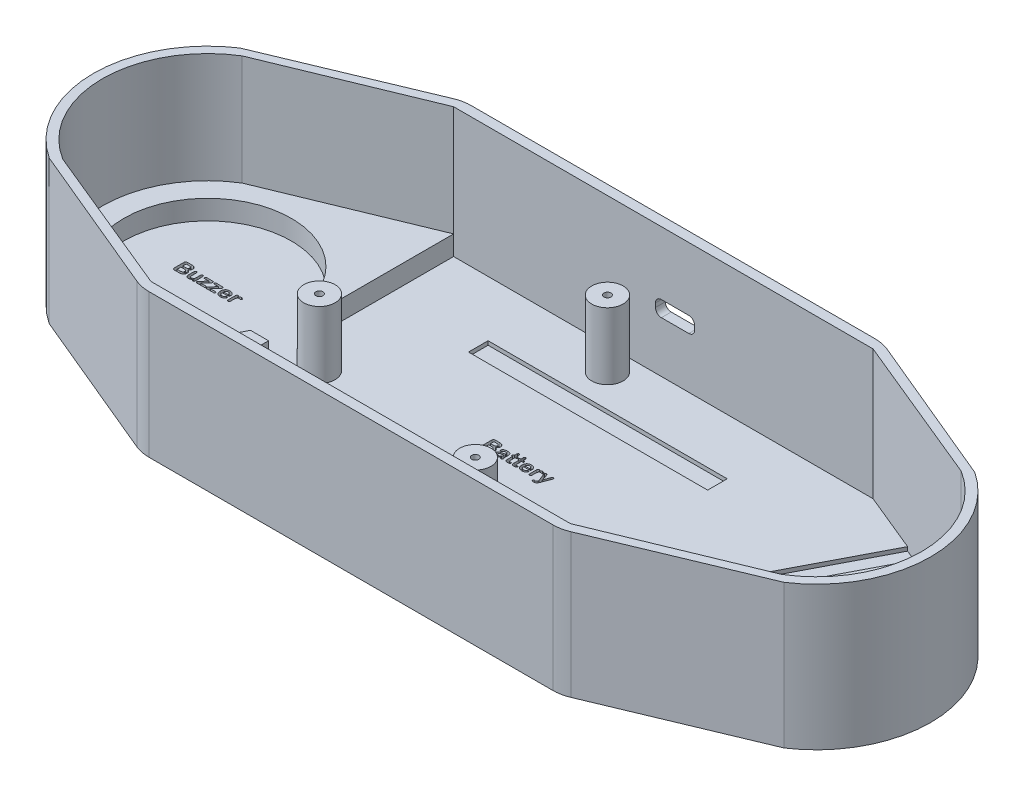
from build123d import *

# Parameters (mm, degrees)
MAINEXTRUDE_DEPTH         = 33.1
MAINCUT_DEPTH             = 50.8
BASSEXTRUDE_START         = -3.5
BASSEXTRUDE_DEPTH         = 3.5
FILLET1_R                 = 10
BUZZER_DEPTH              = 5
TEXT_2_DEPTH              = 1
SKETCH10_W                = 61
SKETCH10_H                = 5
SKETCH10_W_2              = 30.5
BATTERY_COVER_MOLDS_DEPTH = 1
SKETCH11_R                = 4
SKETCH11_R_2              = 0.9
PCB_OFFSETS_DEPTH         = 17
USB_REACH                 = 182.979
SKETCH12_W                = 10
SKETCH12_H                = 4
FILLET2_R                 = 1.5
CUT_EXTRUDE1_DEPTH        = 1


with BuildPart() as part:
    # Sketch2 → MainExtrude (new body)
    with BuildSketch(Plane(origin=(0, 0, 0), x_dir=(1, 0, 0), z_dir=(0, 1, 0))):
        with BuildLine():
            Line((-2.5, 2.5), (104.5, 2.5))
            Line((104.5, 2.5), (144.737244829, -14.291091061))
            ThreePointArc((144.737244829, -14.291091061), (157.8, -38.6), (144.737244829, -62.908908939))
            Line((144.737244829, -62.908908939), (104.5, -79.7))
            Line((104.5, -79.7), (-2.5, -79.7))
            Line((-2.5, -79.7), (-42.737244829, -62.908908939))
            ThreePointArc((-42.737244829, -62.908908939), (-55.8, -38.6), (-42.737244829, -14.291091061))
            Line((-42.737244829, -14.291091061), (-2.5, 2.5))
        make_face()
    extrude(amount=MAINEXTRUDE_DEPTH)

    # Sketch2<5> → MainCut (cut)
    with BuildSketch(Plane(origin=(0, 0, 0), x_dir=(1, 0, 0), z_dir=(0, 1, 0))):
        with BuildLine():
            Line((0, 0), (102, 0))
            Line((102, 0), (104.5, 0))
            Line((104.5, 0), (142.702591635, -15.743739118))
            ThreePointArc((142.702591635, -15.743739118), (155.480653983, -38.6), (142.702591635, -61.456260882))
            Line((142.702591635, -61.456260882), (104.5, -77.2))
            Line((104.5, -77.2), (102, -77.2))
            Line((102, -77.2), (0, -77.2))
            Line((0, -77.2), (-2.5, -77.2))
            Line((-2.5, -77.2), (-40.702591635, -61.456260882))
            ThreePointArc((-40.702591635, -61.456260882), (-53.480653983, -38.6), (-40.702591635, -15.743739118))
            Line((-40.702591635, -15.743739118), (-2.5, 0))
            Line((-2.5, 0), (0, 0))
        make_face()
    extrude(amount=MAINCUT_DEPTH, mode=Mode.SUBTRACT)

    # Sketch2<6> → BassExtrude (add)
    with BuildSketch(Plane(origin=(0, 0, 0), x_dir=(1, 0, 0), z_dir=(0, 1, 0)).offset(BASSEXTRUDE_START)):
        with BuildLine():
            Line((-2.5, 2.5), (104.5, 2.5))
            Line((104.5, 2.5), (144.737244829, -14.291091061))
            ThreePointArc((144.737244829, -14.291091061), (157.8, -38.6), (144.737244829, -62.908908939))
            Line((144.737244829, -62.908908939), (104.5, -79.7))
            Line((104.5, -79.7), (-2.5, -79.7))
            Line((-2.5, -79.7), (-42.737244829, -62.908908939))
            ThreePointArc((-42.737244829, -62.908908939), (-55.8, -38.6), (-42.737244829, -14.291091061))
            Line((-42.737244829, -14.291091061), (-2.5, 2.5))
        make_face()
    extrude(amount=BASSEXTRUDE_DEPTH)

    # Fillet1
    fillet1_edges = [part.edges().sort_by_distance(p)[0] for p in [
        (104.5, 14.8, -2.5),
        (-2.5, 14.8, -2.5),
        (104.5, 14.8, 79.7),
        (-2.5, 14.8, 79.7),
    ]]
    fillet(fillet1_edges, radius=FILLET1_R)

    # Sketch6 → Buzzer (add)
    with BuildSketch(Plane(origin=(0, 0, 0), x_dir=(1, 0, 0), z_dir=(0, 1, 0))):
        with BuildLine():
            Line((-2.5, 0), (-2.5, -30))
            Line((-2.5, -30), (-7.100063939, -30))
            ThreePointArc((-7.100063939, -30), (-48.007902519, -38.6), (-7.100063939, -47.2))
            Line((-7.100063939, -47.2), (-2.5, -47.2))
            Line((-2.5, -47.2), (-2.5, -77.2))
            Line((-2.5, -77.2), (-40.702591635, -61.456260882))
            ThreePointArc((-40.702591635, -61.456260882), (-53.480653983, -38.6), (-40.702591635, -15.743739118))
            Line((-40.702591635, -15.743739118), (-2.5, 0))
        make_face()
    extrude(amount=BUZZER_DEPTH)

    # Sketch8 → Text 2 (cut)
    # profile 1 of 20: a face of its own
    with BuildSketch(Plane(origin=(0, 0, 0), x_dir=(1, 0, 0), z_dir=(0, 1, 0))):
        with BuildLine():
            Line((-21.077826991, -37.737304687), (-21.077826991, -38.261621094))
            add(Edge.make_bspline(
                [(-21.077826991, -38.261621094), (-21.078743598, -38.291555749), (-21.080473832, -38.348061935), (-21.096685556, -38.427007978), (-21.123892906, -38.494561888), (-21.162716624, -38.549380367), (-21.20987706, -38.591921733), (-21.263932483, -38.621921931), (-21.323887979, -38.640329071), (-21.365943788, -38.642590929), (-21.38749496, -38.64375)],
                knots=[0, 0, 0, 0, 1.292414504, 2.439627698, 3.46375878, 4.417332263, 5.316903122, 6.185375834, 7.070109971, 8, 8, 8, 8], degree=3))
            add(Edge.make_bspline(
                [(-21.38749496, -38.64375), (-21.408811222, -38.642592119), (-21.450188357, -38.64034455), (-21.509315323, -38.622087333), (-21.561576004, -38.590831704), (-21.608331386, -38.5489347), (-21.645318225, -38.493691089), (-21.672152661, -38.427227909), (-21.687486024, -38.349350673), (-21.689342129, -38.293820267), (-21.690326991, -38.264355469)],
                knots=[0, 0, 0, 0, 0.933294383, 1.81162385, 2.680186499, 3.585258456, 4.541104918, 5.566887721, 6.708974649, 8, 8, 8, 8], degree=3))
            Line((-21.690326991, -38.264355469), (-21.690326991, -36.526660156))
            add(Edge.make_bspline(
                [(-21.690326991, -36.526660156), (-21.68947206, -36.493793432), (-21.687866447, -36.432067763), (-21.674549456, -36.34577407), (-21.652100802, -36.272036368), (-21.618660935, -36.211573689), (-21.576488272, -36.163130081), (-21.52312796, -36.129252265), (-21.460317801, -36.110028202), (-21.415657975, -36.107548196), (-21.392280116, -36.10625)],
                knots=[0, 0, 0, 0, 1.34619872, 2.528241455, 3.567694465, 4.487339067, 5.340335725, 6.171799567, 7.043000931, 8, 8, 8, 8], degree=3))
            add(Edge.make_bspline(
                [(-21.392280116, -36.10625), (-21.368459953, -36.107322007), (-21.323701205, -36.109336337), (-21.2615399, -36.127044493), (-21.209978479, -36.15799681), (-21.170252342, -36.202368203), (-21.139849326, -36.257679327), (-21.117777191, -36.323909497), (-21.103869745, -36.401498512), (-21.100256557, -36.456874961), (-21.098334804, -36.486328125)],
                knots=[0, 0, 0, 0, 1.044883286, 1.963364657, 2.807970932, 3.650974255, 4.547373518, 5.563477854, 6.704082887, 8, 8, 8, 8], degree=3))
            add(Edge.make_bspline(
                [(-21.098334804, -36.486328125), (-21.079871111, -36.456631468), (-21.044556032, -36.399831357), (-20.986724766, -36.322972828), (-20.92909288, -36.25688943), (-20.869169997, -36.201623906), (-20.803386875, -36.157143274), (-20.727359786, -36.127420725), (-20.641847174, -36.109475258), (-20.58163349, -36.107358691), (-20.550092616, -36.10625)],
                knots=[0, 0, 0, 0, 1.18924255, 2.274636787, 3.268721947, 4.168850259, 5.041860026, 5.953170485, 6.927838526, 8, 8, 8, 8], degree=3))
            add(Edge.make_bspline(
                [(-20.550092616, -36.10625), (-20.51720947, -36.107515125), (-20.451200809, -36.110054699), (-20.353247223, -36.128151245), (-20.257083154, -36.158998544), (-20.179580614, -36.193360452), (-20.121691521, -36.226542883), (-20.083198725, -36.253239033), (-20.051243721, -36.282827859), (-20.023951592, -36.313533808), (-20.003030507, -36.346762118), (-19.988712752, -36.38222059), (-19.979233571, -36.419524906), (-19.978365059, -36.445253911), (-19.977924648, -36.458300781)],
                knots=[0, 0, 0, 0, 1.609451603, 3.230765888, 4.857137694, 6.544750347, 7.369389467, 8.121503283, 8.832102741, 9.496362917, 10.127778221, 10.743023735, 11.362602371, 12, 12, 12, 12], degree=3))
            add(Edge.make_bspline(
                [(-19.977924648, -36.458300781), (-19.978680721, -36.476434934), (-19.980145399, -36.511564748), (-19.996332116, -36.561465036), (-20.020886777, -36.606925113), (-20.056027041, -36.645020515), (-20.095885117, -36.676329313), (-20.138689635, -36.699199495), (-20.183215608, -36.713788041), (-20.213659447, -36.715732139), (-20.228803554, -36.716699219)],
                knots=[0, 0, 0, 0, 1.088483127, 2.10862957, 3.128406662, 4.178128692, 5.204900727, 6.16884502, 7.089102868, 8, 8, 8, 8], degree=3))
            add(Edge.make_bspline(
                [(-20.228803554, -36.716699219), (-20.236576815, -36.715943621), (-20.256688825, -36.713988638), (-20.292325276, -36.704739455), (-20.340512443, -36.691963417), (-20.397596158, -36.673932093), (-20.458687744, -36.65444453), (-20.519698183, -36.642079069), (-20.5764824, -36.632962342), (-20.613178893, -36.631804575), (-20.630756679, -36.63125)],
                knots=[0, 0, 0, 0, 0.454029574, 1.174725489, 2.136679894, 3.357464208, 4.658256254, 5.865202561, 6.977422421, 8, 8, 8, 8], degree=3))
            add(Edge.make_bspline(
                [(-20.630756679, -36.63125), (-20.65267771, -36.63226505), (-20.695101617, -36.634229483), (-20.756149995, -36.646585024), (-20.810167717, -36.670674712), (-20.858497077, -36.702345102), (-20.900172473, -36.744251023), (-20.936983111, -36.794245715), (-20.968460976, -36.853333063), (-20.994796652, -36.920422046), (-21.016145483, -36.995236912), (-21.034520701, -37.076727793), (-21.0496511, -37.165002718), (-21.060132953, -37.260911451), (-21.068411485, -37.365319943), (-21.073504452, -37.479777204), (-21.076991883, -37.604893873), (-21.077540985, -37.691956883), (-21.077826991, -37.737304687)],
                knots=[0, 0, 0, 0, 0.794050632, 1.536731085, 2.238662641, 2.922771156, 3.616952249, 4.366019506, 5.163320251, 6.033432924, 6.970572952, 7.977209821, 9.05675488, 10.211001348, 11.468820729, 12.84806026, 14.358274693, 16, 16, 16, 16], degree=3))
        make_face()
    # profile 2 of 20: a face of its own
    with BuildSketch(Plane(origin=(0, 0, 0), x_dir=(1, 0, 0), z_dir=(0, 1, 0))):
        with BuildLine():
            Line((-22.77655746, -37.50625), (-24.009076991, -37.50625))
            add(Edge.make_bspline(
                [(-24.009076991, -37.50625), (-24.007871775, -37.54050984), (-24.005510154, -37.607642015), (-23.987751688, -37.704799922), (-23.961351053, -37.796051007), (-23.924534116, -37.880178801), (-23.878589056, -37.955719266), (-23.8267399, -38.023232232), (-23.766600162, -38.079761377), (-23.699878245, -38.125891175), (-23.6277054, -38.161111212), (-23.55193915, -38.187825623), (-23.472126742, -38.202770727), (-23.417825652, -38.205083132), (-23.390424648, -38.20625)],
                knots=[0, 0, 0, 0, 1.179639705, 2.311504614, 3.392005435, 4.44652888, 5.46432702, 6.431680492, 7.370191764, 8.295643874, 9.215452015, 10.129041871, 11.055891293, 12, 12, 12, 12], degree=3))
            add(Edge.make_bspline(
                [(-23.390424648, -38.20625), (-23.354344988, -38.204901959), (-23.284833636, -38.202304814), (-23.183776953, -38.183228093), (-23.089964103, -38.147801168), (-23.001389537, -38.09969969), (-22.919114496, -38.041546046), (-22.852748068, -37.989032118), (-22.799708742, -37.942051298), (-22.755032981, -37.901005221), (-22.703962542, -37.855277789), (-22.668714297, -37.822367176), (-22.650092616, -37.804980469)],
                knots=[0, 0, 0, 0, 1.247905556, 2.404224554, 3.538983975, 4.702801183, 5.881313568, 7.020008393, 7.628790321, 8.331868978, 9.11872483, 10, 10, 10, 10], degree=3))
            add(Edge.make_bspline(
                [(-22.650092616, -37.804980469), (-22.641432631, -37.798664417), (-22.623406333, -37.785517162), (-22.590375585, -37.772827874), (-22.552439987, -37.765514021), (-22.52548771, -37.76449853), (-22.511323085, -37.763964844)],
                knots=[0, 0, 0, 0, 0.868866131, 1.808598965, 2.848320883, 4, 4, 4, 4], degree=3))
            add(Edge.make_bspline(
                [(-22.511323085, -37.763964844), (-22.495749522, -37.764510974), (-22.466049804, -37.765552476), (-22.424102867, -37.776480706), (-22.386160017, -37.792514376), (-22.353936665, -37.817106482), (-22.326801456, -37.846830412), (-22.308049303, -37.883410036), (-22.295952673, -37.924979255), (-22.295079778, -37.954822893), (-22.294623866, -37.970410156)],
                knots=[0, 0, 0, 0, 1.102465736, 2.102468148, 3.057950005, 4.00546365, 4.956145095, 5.889200524, 6.897534264, 8, 8, 8, 8], degree=3))
            add(Edge.make_bspline(
                [(-22.294623866, -37.970410156), (-22.295519034, -37.985514577), (-22.297416669, -38.017533916), (-22.310558862, -38.067069834), (-22.332294827, -38.119761652), (-22.361659753, -38.175464467), (-22.398838035, -38.232880057), (-22.446132607, -38.288793124), (-22.500901121, -38.34446355), (-22.564533445, -38.398157518), (-22.636138207, -38.449559597), (-22.716873638, -38.496395146), (-22.806729163, -38.537394308), (-22.904258306, -38.575443278), (-23.010050095, -38.606227579), (-23.124042111, -38.627726535), (-23.245371913, -38.641912735), (-23.329086982, -38.64312768), (-23.371967616, -38.64375)],
                knots=[0, 0, 0, 0, 0.525537938, 1.114069654, 1.772306998, 2.506549159, 3.302753817, 4.147512317, 5.050313588, 6.017967943, 7.041213872, 8.114344659, 9.260276936, 10.47524946, 11.755151616, 13.087980653, 14.508401902, 16, 16, 16, 16], degree=3))
            add(Edge.make_bspline(
                [(-23.371967616, -38.64375), (-23.421000456, -38.64268888), (-23.516593401, -38.640620152), (-23.655468827, -38.6249168), (-23.785569269, -38.598552135), (-23.906585554, -38.560614588), (-24.019298723, -38.51319878), (-24.122772676, -38.453893119), (-24.216893369, -38.383689553), (-24.302111122, -38.303472224), (-24.377015227, -38.213461976), (-24.443305793, -38.116315317), (-24.497907966, -38.010657469), (-24.543288639, -37.897837544), (-24.578691403, -37.777418449), (-24.603885856, -37.649303072), (-24.619140171, -37.513686139), (-24.620751696, -37.420613602), (-24.621576991, -37.372949219)],
                knots=[0, 0, 0, 0, 1.161895415, 2.265196273, 3.307380836, 4.303185105, 5.266158709, 6.199917451, 7.122316156, 8.043005893, 8.966794753, 9.89246016, 10.824859252, 11.779559524, 12.770652002, 13.794812853, 14.87067777, 16, 16, 16, 16], degree=3))
            add(Edge.make_bspline(
                [(-24.621576991, -37.372949219), (-24.620750322, -37.327787163), (-24.619121437, -37.238799026), (-24.603462122, -37.107846683), (-24.579079841, -36.981869864), (-24.545181862, -36.86109299), (-24.500745887, -36.747558667), (-24.448216706, -36.641113687), (-24.385495812, -36.543752253), (-24.314518117, -36.454159081), (-24.233156199, -36.374384094), (-24.142156335, -36.304039645), (-24.041301329, -36.243943784), (-23.931198574, -36.193998512), (-23.813052147, -36.154311467), (-23.687424047, -36.126836066), (-23.55522893, -36.108964864), (-23.464769057, -36.10716934), (-23.418451991, -36.10625)],
                knots=[0, 0, 0, 0, 1.095507523, 2.15860795, 3.195309999, 4.206995944, 5.197887526, 6.149926361, 7.082497361, 8.003040645, 8.917987058, 9.840388418, 10.787726911, 11.760164811, 12.769081724, 13.806049167, 14.876658106, 16, 16, 16, 16], degree=3))
            add(Edge.make_bspline(
                [(-23.418451991, -36.10625), (-23.388126065, -36.106492315), (-23.328741274, -36.106966822), (-23.241389958, -36.11516352), (-23.157134373, -36.126499456), (-23.075882176, -36.142489392), (-22.998459527, -36.164833925), (-22.924139137, -36.19074284), (-22.852957461, -36.22135615), (-22.785523373, -36.257258876), (-22.72115426, -36.295648165), (-22.661879403, -36.338745129), (-22.60547126, -36.382602252), (-22.553904476, -36.430449552), (-22.50601103, -36.480600288), (-22.463137215, -36.534262423), (-22.423544291, -36.58986635), (-22.378117014, -36.667411557), (-22.330552299, -36.766964199), (-22.288144833, -36.889214664), (-22.262515143, -37.013450489), (-22.259308167, -37.09689009), (-22.257709804, -37.138476563)],
                knots=[0, 0, 0, 0, 1.048847282, 2.053872234, 3.03283051, 3.989924751, 4.915857681, 5.818505585, 6.711913066, 7.593554535, 8.460263899, 9.302531452, 10.127499996, 10.930978608, 11.734070318, 12.524563272, 13.305443929, 14.093732096, 15.631266151, 17.114748765, 18.561984696, 20, 20, 20, 20], degree=3))
            add(Edge.make_bspline(
                [(-22.257709804, -37.138476563), (-22.258075939, -37.156950286), (-22.258774317, -37.192187729), (-22.264766524, -37.242641004), (-22.275538355, -37.287876309), (-22.290872735, -37.328206752), (-22.309437949, -37.363941258), (-22.333402025, -37.393953017), (-22.361124221, -37.419277123), (-22.405876029, -37.445937316), (-22.471538887, -37.470750953), (-22.561191571, -37.491638337), (-22.664314384, -37.504395032), (-22.737781847, -37.505609181), (-22.77655746, -37.50625)],
                knots=[0, 0, 0, 0, 0.899856074, 1.716417764, 2.470354694, 3.159019517, 3.814679391, 4.423252287, 5.02068589, 5.633798556, 6.949059873, 8.421953477, 10.111532063, 12, 12, 12, 12], degree=3))
        make_face()
        with BuildLine():
            Line((-24.009076991, -37.15625), (-22.866791835, -37.15625))
            add(Edge.make_bspline(
                [(-22.866791835, -37.15625), (-22.868877023, -37.131358342), (-22.872933626, -37.082933192), (-22.885828321, -37.013200758), (-22.900984295, -36.94812625), (-22.921085155, -36.888027662), (-22.944791792, -36.832872869), (-22.972333956, -36.782022874), (-23.004328356, -36.736479501), (-23.040155424, -36.695724429), (-23.079557672, -36.660004871), (-23.121665836, -36.628448319), (-23.167392559, -36.60215675), (-23.21620494, -36.581300383), (-23.267451609, -36.563671989), (-23.322166557, -36.552633171), (-23.379469122, -36.544471253), (-23.418876095, -36.543993491), (-23.438959804, -36.54375)],
                knots=[0, 0, 0, 0, 1.274652096, 2.479755284, 3.617009281, 4.684005428, 5.71065458, 6.679155714, 7.63137599, 8.546404667, 9.444107911, 10.342338794, 11.228430864, 12.129821099, 13.049645363, 13.989847955, 14.975528821, 16, 16, 16, 16], degree=3))
            add(Edge.make_bspline(
                [(-23.438959804, -36.54375), (-23.458117074, -36.544376494), (-23.495640539, -36.545603612), (-23.550894309, -36.552274194), (-23.603344298, -36.564547436), (-23.653205118, -36.581919915), (-23.700480464, -36.603728542), (-23.745150857, -36.63056856), (-23.787075204, -36.662197752), (-23.826130782, -36.698711786), (-23.86253241, -36.739575621), (-23.89461304, -36.785601432), (-23.922624317, -36.836239614), (-23.948170585, -36.890831867), (-23.96926318, -36.950617934), (-23.986089048, -37.015177465), (-23.999834592, -37.084120549), (-24.005947089, -37.131823646), (-24.009076991, -37.15625)],
                knots=[0, 0, 0, 0, 0.988988761, 1.937138454, 2.867098831, 3.763434994, 4.657917626, 5.549380048, 6.447873833, 7.363218941, 8.304708192, 9.267190604, 10.251834605, 11.288414524, 12.374576878, 13.518478699, 14.729337904, 16, 16, 16, 16], degree=3))
        make_face(mode=Mode.SUBTRACT)
    # profile 3 of 20: a face of its own
    with BuildSketch(Plane(origin=(0, 0, 0), x_dir=(1, 0, 0), z_dir=(0, 1, 0))):
        with BuildLine():
            Line((-25.266205898, -36.841796875), (-26.417377773, -38.11875))
            Line((-26.417377773, -38.11875), (-25.185541835, -38.11875))
            add(Edge.make_bspline(
                [(-25.185541835, -38.11875), (-25.16200086, -38.119365823), (-25.117695493, -38.120524834), (-25.055648749, -38.133550992), (-25.002613376, -38.155157458), (-24.959320123, -38.185984533), (-24.925252187, -38.222990339), (-24.90152766, -38.266232341), (-24.886627183, -38.313972822), (-24.88493927, -38.34764312), (-24.884076991, -38.36484375)],
                knots=[0, 0, 0, 0, 1.283919702, 2.416405184, 3.442575592, 4.388657961, 5.296057095, 6.16510038, 7.062632923, 8, 8, 8, 8], degree=3))
            add(Edge.make_bspline(
                [(-24.884076991, -38.36484375), (-24.885034335, -38.381327639), (-24.886904348, -38.413526197), (-24.900469909, -38.45984631), (-24.925770203, -38.500228356), (-24.958610408, -38.536536792), (-25.001990498, -38.565442256), (-25.054844826, -38.586011269), (-25.117104953, -38.598016993), (-25.161787752, -38.599311709), (-25.185541835, -38.6)],
                knots=[0, 0, 0, 0, 0.916513354, 1.790257649, 2.648524737, 3.545118245, 4.49390242, 5.517321921, 6.680169007, 8, 8, 8, 8], degree=3))
            Line((-25.185541835, -38.6), (-26.889741054, -38.6))
            add(Edge.make_bspline(
                [(-26.889741054, -38.6), (-26.917826039, -38.599174411), (-26.970768546, -38.597618107), (-27.044937348, -38.583785529), (-27.107603769, -38.559128218), (-27.159371736, -38.525404469), (-27.198145964, -38.481597148), (-27.227075862, -38.431570742), (-27.24374574, -38.373842021), (-27.24560911, -38.333277348), (-27.246576991, -38.312207031)],
                knots=[0, 0, 0, 0, 1.294646989, 2.440516117, 3.459144083, 4.383062955, 5.261017038, 6.131708653, 7.029562239, 8, 8, 8, 8], degree=3))
            add(Edge.make_bspline(
                [(-27.246576991, -38.312207031), (-27.24569585, -38.298914152), (-27.243886861, -38.27162378), (-27.231652299, -38.2311432), (-27.211994593, -38.190590903), (-27.188651434, -38.157355087), (-27.165656407, -38.128201323), (-27.143300123, -38.102159466), (-27.117589159, -38.071402949), (-27.087466337, -38.0365724), (-27.053004802, -37.997628371), (-27.015247875, -37.953662189), (-26.971612562, -37.906957508), (-26.942071562, -37.873638211), (-26.926655116, -37.85625)],
                knots=[0, 0, 0, 0, 0.843414844, 1.731536494, 2.663118638, 3.694160692, 4.301839563, 5.020418296, 5.872348335, 6.846633684, 7.943359171, 9.173432467, 10.524910229, 12, 12, 12, 12], degree=3))
            add(Edge.make_bspline(
                [(-26.926655116, -37.85625), (-26.89293753, -37.819102287), (-26.827130037, -37.746600125), (-26.730537165, -37.640395328), (-26.638677497, -37.539706634), (-26.524412303, -37.414704868), (-26.390435928, -37.267932285), (-26.262276533, -37.126743495), (-26.16787247, -37.02132311), (-26.104586014, -36.949719556), (-26.047485344, -36.88466358), (-25.996389888, -36.825041286), (-25.950240313, -36.771281642), (-25.909800149, -36.72085282), (-25.873708087, -36.675050474), (-25.851964789, -36.645210918), (-25.841791835, -36.63125)],
                knots=[0, 0, 0, 0, 1.287276655, 2.512411466, 3.683665534, 4.784520393, 6.858009896, 8.782831597, 9.677227646, 10.489077017, 11.234911419, 11.898264819, 12.503914934, 13.052709621, 13.556794895, 14, 14, 14, 14], degree=3))
            Line((-25.841791835, -36.63125), (-26.776264491, -36.63125))
            add(Edge.make_bspline(
                [(-26.776264491, -36.63125), (-26.806579887, -36.630955839), (-26.863200068, -36.630406433), (-26.942572068, -36.623911949), (-27.009935737, -36.612153142), (-27.067376254, -36.598375501), (-27.11462644, -36.571439715), (-27.147207656, -36.527359315), (-27.165419984, -36.468747635), (-27.167061013, -36.42540461), (-27.16796371, -36.4015625)],
                knots=[0, 0, 0, 0, 1.378470275, 2.57457421, 3.615406827, 4.487892749, 5.250242607, 6.033638734, 6.918344941, 8, 8, 8, 8], degree=3))
            add(Edge.make_bspline(
                [(-27.16796371, -36.4015625), (-27.167082826, -36.383238853), (-27.165392824, -36.348084392), (-27.151367216, -36.298123224), (-27.12781239, -36.254002954), (-27.094144719, -36.216576255), (-27.052105948, -36.186133773), (-27.001336947, -36.165012363), (-26.943275437, -36.151838488), (-26.901895437, -36.150632926), (-26.880170741, -36.15)],
                knots=[0, 0, 0, 0, 1.015207254, 1.947705206, 2.852719541, 3.7660833, 4.716910535, 5.707900981, 6.79663718, 8, 8, 8, 8], degree=3))
            Line((-26.880170741, -36.15), (-25.436420741, -36.15))
            add(Edge.make_bspline(
                [(-25.436420741, -36.15), (-25.40495878, -36.150870413), (-25.345696739, -36.152509932), (-25.262312336, -36.162285995), (-25.191014083, -36.182656677), (-25.130022123, -36.208364899), (-25.079986653, -36.245259528), (-25.045363781, -36.29653328), (-25.025499297, -36.359833663), (-25.023325012, -36.405738704), (-25.022162929, -36.430273438)],
                knots=[0, 0, 0, 0, 1.320440648, 2.487194138, 3.510092406, 4.421497899, 5.253218846, 6.077878093, 6.972689113, 8, 8, 8, 8], degree=3))
            add(Edge.make_bspline(
                [(-25.022162929, -36.430273438), (-25.023312195, -36.448159925), (-25.025695636, -36.485254374), (-25.042324973, -36.538759684), (-25.063008355, -36.58822626), (-25.08857891, -36.632589601), (-25.121713045, -36.67403667), (-25.160485267, -36.722233256), (-25.210073673, -36.778726685), (-25.246355055, -36.81949246), (-25.266205898, -36.841796875)],
                knots=[0, 0, 0, 0, 0.87583533, 1.816378314, 2.727200703, 3.503097911, 4.316290601, 5.324632212, 6.53621054, 8, 8, 8, 8], degree=3))
        make_face()
    # profile 4 of 20: a face of its own
    with BuildSketch(Plane(origin=(0, 0, 0), x_dir=(1, 0, 0), z_dir=(0, 1, 0))):
        with BuildLine():
            Line((-27.716205898, -36.841796875), (-28.867377773, -38.11875))
            Line((-28.867377773, -38.11875), (-27.635541835, -38.11875))
            add(Edge.make_bspline(
                [(-27.635541835, -38.11875), (-27.61200086, -38.119365823), (-27.567695493, -38.120524834), (-27.505648749, -38.133550992), (-27.452613376, -38.155157458), (-27.409320123, -38.185984533), (-27.375252187, -38.222990339), (-27.35152766, -38.266232341), (-27.336627183, -38.313972822), (-27.33493927, -38.34764312), (-27.334076991, -38.36484375)],
                knots=[0, 0, 0, 0, 1.283919702, 2.416405184, 3.442575592, 4.388657961, 5.296057095, 6.16510038, 7.062632923, 8, 8, 8, 8], degree=3))
            add(Edge.make_bspline(
                [(-27.334076991, -38.36484375), (-27.335034335, -38.381327639), (-27.336904348, -38.413526197), (-27.350469909, -38.45984631), (-27.375770203, -38.500228356), (-27.408610408, -38.536536792), (-27.451990498, -38.565442256), (-27.504844826, -38.586011269), (-27.567104953, -38.598016993), (-27.611787752, -38.599311709), (-27.635541835, -38.6)],
                knots=[0, 0, 0, 0, 0.916513354, 1.790257649, 2.648524737, 3.545118245, 4.49390242, 5.517321921, 6.680169007, 8, 8, 8, 8], degree=3))
            Line((-27.635541835, -38.6), (-29.339741054, -38.6))
            add(Edge.make_bspline(
                [(-29.339741054, -38.6), (-29.367826039, -38.599174411), (-29.420768546, -38.597618107), (-29.494937348, -38.583785529), (-29.557603769, -38.559128218), (-29.609371736, -38.525404469), (-29.648145964, -38.481597148), (-29.677075862, -38.431570742), (-29.69374574, -38.373842021), (-29.69560911, -38.333277348), (-29.696576991, -38.312207031)],
                knots=[0, 0, 0, 0, 1.294646989, 2.440516117, 3.459144083, 4.383062955, 5.261017038, 6.131708653, 7.029562239, 8, 8, 8, 8], degree=3))
            add(Edge.make_bspline(
                [(-29.696576991, -38.312207031), (-29.69569585, -38.298914152), (-29.693886861, -38.27162378), (-29.681652299, -38.2311432), (-29.661994593, -38.190590903), (-29.638651434, -38.157355087), (-29.615656407, -38.128201323), (-29.593300123, -38.102159466), (-29.567589159, -38.071402949), (-29.537466337, -38.0365724), (-29.503004802, -37.997628371), (-29.465247875, -37.953662189), (-29.421612562, -37.906957508), (-29.392071562, -37.873638211), (-29.376655116, -37.85625)],
                knots=[0, 0, 0, 0, 0.843414844, 1.731536494, 2.663118638, 3.694160692, 4.301839563, 5.020418296, 5.872348335, 6.846633684, 7.943359171, 9.173432467, 10.524910229, 12, 12, 12, 12], degree=3))
            add(Edge.make_bspline(
                [(-29.376655116, -37.85625), (-29.34293753, -37.819102287), (-29.277130037, -37.746600125), (-29.180537165, -37.640395328), (-29.088677497, -37.539706634), (-28.974412303, -37.414704868), (-28.840435928, -37.267932285), (-28.712276533, -37.126743495), (-28.61787247, -37.02132311), (-28.554586014, -36.949719556), (-28.497485344, -36.88466358), (-28.446389888, -36.825041286), (-28.400240313, -36.771281642), (-28.359800149, -36.72085282), (-28.323708087, -36.675050474), (-28.301964789, -36.645210918), (-28.291791835, -36.63125)],
                knots=[0, 0, 0, 0, 1.287276655, 2.512411466, 3.683665534, 4.784520393, 6.858009896, 8.782831597, 9.677227646, 10.489077017, 11.234911419, 11.898264819, 12.503914934, 13.052709621, 13.556794895, 14, 14, 14, 14], degree=3))
            Line((-28.291791835, -36.63125), (-29.226264491, -36.63125))
            add(Edge.make_bspline(
                [(-29.226264491, -36.63125), (-29.256579887, -36.630955839), (-29.313200068, -36.630406433), (-29.392572068, -36.623911949), (-29.459935737, -36.612153142), (-29.517376254, -36.598375501), (-29.56462644, -36.571439715), (-29.597207656, -36.527359315), (-29.615419984, -36.468747635), (-29.617061013, -36.42540461), (-29.61796371, -36.4015625)],
                knots=[0, 0, 0, 0, 1.378470275, 2.57457421, 3.615406827, 4.487892749, 5.250242607, 6.033638734, 6.918344941, 8, 8, 8, 8], degree=3))
            add(Edge.make_bspline(
                [(-29.61796371, -36.4015625), (-29.617082826, -36.383238853), (-29.615392824, -36.348084392), (-29.601367216, -36.298123224), (-29.57781239, -36.254002954), (-29.544144719, -36.216576255), (-29.502105948, -36.186133773), (-29.451336947, -36.165012363), (-29.393275437, -36.151838488), (-29.351895437, -36.150632926), (-29.330170741, -36.15)],
                knots=[0, 0, 0, 0, 1.015207254, 1.947705206, 2.852719541, 3.7660833, 4.716910535, 5.707900981, 6.79663718, 8, 8, 8, 8], degree=3))
            Line((-29.330170741, -36.15), (-27.886420741, -36.15))
            add(Edge.make_bspline(
                [(-27.886420741, -36.15), (-27.85495878, -36.150870413), (-27.795696739, -36.152509932), (-27.712312336, -36.162285995), (-27.641014083, -36.182656677), (-27.580022123, -36.208364899), (-27.529986653, -36.245259528), (-27.495363781, -36.29653328), (-27.475499297, -36.359833663), (-27.473325012, -36.405738704), (-27.472162929, -36.430273437)],
                knots=[0, 0, 0, 0, 1.320440648, 2.487194138, 3.510092406, 4.421497899, 5.253218846, 6.077878093, 6.972689113, 8, 8, 8, 8], degree=3))
            add(Edge.make_bspline(
                [(-27.472162929, -36.430273437), (-27.473312195, -36.448159925), (-27.475695636, -36.485254374), (-27.492324973, -36.538759684), (-27.513008355, -36.58822626), (-27.53857891, -36.632589601), (-27.571713045, -36.67403667), (-27.610485267, -36.722233256), (-27.660073673, -36.778726685), (-27.696355055, -36.81949246), (-27.716205898, -36.841796875)],
                knots=[0, 0, 0, 0, 0.87583533, 1.816378314, 2.727200703, 3.503097911, 4.316290601, 5.324632212, 6.53621054, 8, 8, 8, 8], degree=3))
        make_face()
    # profile 5 of 20: a face of its own
    with BuildSketch(Plane(origin=(0, 0, 0), x_dir=(1, 0, 0), z_dir=(0, 1, 0))):
        with BuildLine():
            Line((-30.622846523, -38.297167969), (-30.622846523, -38.2171875))
            add(Edge.make_bspline(
                [(-30.622846523, -38.2171875), (-30.641743288, -38.239958071), (-30.67886343, -38.284687779), (-30.737865832, -38.347135983), (-30.798455164, -38.403669111), (-30.86046013, -38.454689491), (-30.923971716, -38.500619269), (-30.99156698, -38.538553685), (-31.061294489, -38.57171056), (-31.134470294, -38.598593409), (-31.211779164, -38.61932258), (-31.293967807, -38.633153679), (-31.381191811, -38.642512329), (-31.441081943, -38.643329773), (-31.47186996, -38.64375)],
                knots=[0, 0, 0, 0, 1.077213554, 2.116040354, 3.125733004, 4.092446053, 5.038610977, 5.975086391, 6.910384958, 7.84748497, 8.809486843, 9.820235676, 10.87943775, 12, 12, 12, 12], degree=3))
            add(Edge.make_bspline(
                [(-31.47186996, -38.64375), (-31.509072546, -38.642486735), (-31.582054525, -38.640008532), (-31.68868827, -38.622939352), (-31.789243761, -38.593370461), (-31.882881068, -38.55235733), (-31.968595541, -38.501368489), (-32.044127047, -38.440375008), (-32.111592114, -38.37217009), (-32.146281642, -38.319019867), (-32.163666835, -38.292382813)],
                knots=[0, 0, 0, 0, 1.100659763, 2.159213586, 3.185386709, 4.19377494, 5.176617491, 6.126388902, 7.061010856, 8, 8, 8, 8], degree=3))
            add(Edge.make_bspline(
                [(-32.163666835, -38.292382813), (-32.172890019, -38.274994839), (-32.191895722, -38.239164409), (-32.214677336, -38.180602024), (-32.234782594, -38.116980434), (-32.249781339, -38.047738206), (-32.263312942, -37.97352121), (-32.271843692, -37.89379376), (-32.276389456, -37.808452519), (-32.277336963, -37.749842793), (-32.277826991, -37.71953125)],
                knots=[0, 0, 0, 0, 0.799685433, 1.647867272, 2.550423266, 3.510135232, 4.526111565, 5.616776441, 6.767453979, 8, 8, 8, 8], degree=3))
            Line((-32.277826991, -37.71953125), (-32.277826991, -36.479492188))
            add(Edge.make_bspline(
                [(-32.277826991, -36.479492188), (-32.276745194, -36.450270207), (-32.274700613, -36.395041125), (-32.260574983, -36.317759545), (-32.234218688, -36.252136702), (-32.197600644, -36.198393604), (-32.151844059, -36.156464994), (-32.098380166, -36.12759331), (-32.038920858, -36.108633378), (-31.996795124, -36.107062785), (-31.97499496, -36.10625)],
                knots=[0, 0, 0, 0, 1.287996314, 2.434292762, 3.443239424, 4.382019993, 5.277808443, 6.149863178, 7.042549956, 8, 8, 8, 8], degree=3))
            add(Edge.make_bspline(
                [(-31.97499496, -36.10625), (-31.952793143, -36.107474133), (-31.909961129, -36.109835746), (-31.848543549, -36.126897274), (-31.795130325, -36.15810545), (-31.748335781, -36.199782659), (-31.710000685, -36.253373731), (-31.683706148, -36.319196822), (-31.668061647, -36.39604852), (-31.666277763, -36.45092684), (-31.665326991, -36.480175781)],
                knots=[0, 0, 0, 0, 0.96982084, 1.870990135, 2.753882516, 3.649259288, 4.591294098, 5.604447936, 6.723223282, 8, 8, 8, 8], degree=3))
            Line((-31.665326991, -36.480175781), (-31.665326991, -37.481640625))
            add(Edge.make_bspline(
                [(-31.665326991, -37.481640625), (-31.665111404, -37.516522684), (-31.664697977, -37.583415184), (-31.656667531, -37.679442343), (-31.645658788, -37.766755551), (-31.629551523, -37.845632303), (-31.607241011, -37.916383805), (-31.577217233, -37.979257558), (-31.539206965, -38.034036735), (-31.493760103, -38.080809008), (-31.43941646, -38.117671566), (-31.376446115, -38.143793301), (-31.304933311, -38.159624211), (-31.254345484, -38.161510955), (-31.227826991, -38.1625)],
                knots=[0, 0, 0, 0, 1.358767114, 2.605675635, 3.752183402, 4.786591833, 5.738481976, 6.635976532, 7.490681591, 8.325744213, 9.163069626, 10.030501431, 10.967575096, 12, 12, 12, 12], degree=3))
            add(Edge.make_bspline(
                [(-31.227826991, -38.1625), (-31.201081551, -38.161220997), (-31.147958349, -38.158680573), (-31.069437304, -38.141089774), (-30.993661279, -38.111089688), (-30.921233073, -38.070385296), (-30.854493964, -38.02028609), (-30.796678086, -37.961824513), (-30.748418408, -37.896221491), (-30.724897248, -37.84777541), (-30.713080898, -37.8234375)],
                knots=[0, 0, 0, 0, 0.985985338, 1.958415976, 2.950789168, 3.981548577, 5.013369089, 6.017482566, 7.004040568, 8, 8, 8, 8], degree=3))
            add(Edge.make_bspline(
                [(-30.713080898, -37.8234375), (-30.708480251, -37.810758104), (-30.698293262, -37.782682732), (-30.688025563, -37.734196051), (-30.679418841, -37.675954575), (-30.672173983, -37.607972904), (-30.665840621, -37.530265402), (-30.662206471, -37.442701617), (-30.659203257, -37.34517049), (-30.659120364, -37.276793342), (-30.659076991, -37.241015625)],
                knots=[0, 0, 0, 0, 0.550679927, 1.219343839, 2.020083156, 2.956918232, 4.012527012, 5.205795046, 6.537957854, 8, 8, 8, 8], degree=3))
            Line((-30.659076991, -37.241015625), (-30.659076991, -36.480175781))
            add(Edge.make_bspline(
                [(-30.659076991, -36.480175781), (-30.658126229, -36.450926806), (-30.656342361, -36.396048422), (-30.640697748, -36.319197146), (-30.614403579, -36.25337267), (-30.576067248, -36.199786249), (-30.529277011, -36.158092831), (-30.476038689, -36.127055314), (-30.415150896, -36.109806073), (-30.372755763, -36.107464156), (-30.35077621, -36.10625)],
                knots=[0, 0, 0, 0, 1.279892668, 2.401398365, 3.417024787, 4.361358616, 5.258920538, 6.143967603, 7.037748896, 8, 8, 8, 8], degree=3))
            add(Edge.make_bspline(
                [(-30.35077621, -36.10625), (-30.328744965, -36.107041832), (-30.286385186, -36.108564298), (-30.226711908, -36.127596696), (-30.173225813, -36.156450996), (-30.12769608, -36.198320927), (-30.090612187, -36.251833037), (-30.063916503, -36.317239203), (-30.049613496, -36.394801108), (-30.047632975, -36.450039758), (-30.046576991, -36.479492188)],
                knots=[0, 0, 0, 0, 0.965643254, 1.856655665, 2.727074731, 3.621182997, 4.549963034, 5.570102879, 6.704414847, 8, 8, 8, 8], degree=3))
            Line((-30.046576991, -36.479492188), (-30.046576991, -38.291015625))
            add(Edge.make_bspline(
                [(-30.046576991, -38.291015625), (-30.047307548, -38.319118768), (-30.048680068, -38.371917047), (-30.063632199, -38.445772531), (-30.088836956, -38.508649571), (-30.124011579, -38.560379894), (-30.167743632, -38.599971921), (-30.217689277, -38.627703748), (-30.272970093, -38.645964257), (-30.312116879, -38.647660028), (-30.332319179, -38.648535156)],
                knots=[0, 0, 0, 0, 1.3031517, 2.448273035, 3.477567788, 4.428200473, 5.32686198, 6.188856372, 7.065331508, 8, 8, 8, 8], degree=3))
            add(Edge.make_bspline(
                [(-30.332319179, -38.648535156), (-30.35251777, -38.647655258), (-30.392162368, -38.645928246), (-30.448353774, -38.627234702), (-30.499008704, -38.59783507), (-30.542978583, -38.557083642), (-30.578870713, -38.505643109), (-30.605132233, -38.444345592), (-30.619709187, -38.373488904), (-30.621766606, -38.323438741), (-30.622846523, -38.297167969)],
                knots=[0, 0, 0, 0, 0.942845484, 1.850561313, 2.739968282, 3.668761993, 4.633806348, 5.656583732, 6.76996697, 8, 8, 8, 8], degree=3))
        make_face()
    # profile 6 of 20: a face of its own
    with BuildSketch(Plane(origin=(0, 0, 0), x_dir=(1, 0, 0), z_dir=(0, 1, 0))):
        with BuildLine():
            Line((-34.163178554, -38.6), (-35.189936366, -38.6))
            add(Edge.make_bspline(
                [(-35.189936366, -38.6), (-35.207948917, -38.599816065), (-35.24245009, -38.599463757), (-35.292286368, -38.594616397), (-35.337963059, -38.586440259), (-35.379860218, -38.575627046), (-35.417962353, -38.561919732), (-35.452285184, -38.545231242), (-35.481950121, -38.52411113), (-35.517514812, -38.49287699), (-35.553419789, -38.441998589), (-35.582191538, -38.367633777), (-35.599838905, -38.27929295), (-35.601785282, -38.215684274), (-35.602826991, -38.181640625)],
                knots=[0, 0, 0, 0, 0.950729654, 1.821024047, 2.639907261, 3.398604693, 4.102683231, 4.775219685, 5.406000082, 6.019447712, 7.268382492, 8.644570224, 10.204158913, 12, 12, 12, 12], degree=3))
            Line((-35.602826991, -38.181640625), (-35.602826991, -35.649609375))
            add(Edge.make_bspline(
                [(-35.602826991, -35.649609375), (-35.601879317, -35.614866885), (-35.600117467, -35.550276035), (-35.581565712, -35.461058722), (-35.55225528, -35.386477772), (-35.508182552, -35.326404934), (-35.448787801, -35.282118561), (-35.374925972, -35.252348843), (-35.287201537, -35.234128011), (-35.223759864, -35.232250815), (-35.189936366, -35.23125)],
                knots=[0, 0, 0, 0, 1.222174323, 2.272182497, 3.193385757, 4.024939207, 4.86132091, 5.767718531, 6.809874283, 8, 8, 8, 8], degree=3))
            Line((-35.189936366, -35.23125), (-34.101655116, -35.23125))
            add(Edge.make_bspline(
                [(-34.101655116, -35.23125), (-34.062913096, -35.231689105), (-33.987895703, -35.232539357), (-33.879540303, -35.237743576), (-33.779175247, -35.247326212), (-33.686114175, -35.260557348), (-33.599251153, -35.279849871), (-33.517103904, -35.304634532), (-33.440243591, -35.338546715), (-33.3920935, -35.365962158), (-33.368159023, -35.379589844)],
                knots=[0, 0, 0, 0, 1.226361742, 2.374642816, 3.432537546, 4.416889029, 5.347867328, 6.246718495, 7.128477734, 8, 8, 8, 8], degree=3))
            add(Edge.make_bspline(
                [(-33.368159023, -35.379589844), (-33.348337698, -35.392018723), (-33.308696931, -35.416875301), (-33.253290127, -35.460123171), (-33.201810533, -35.508565799), (-33.153546579, -35.560654534), (-33.109656737, -35.616757557), (-33.071235187, -35.676148435), (-33.039212505, -35.738951299), (-33.011698598, -35.803947949), (-32.989583172, -35.87130054), (-32.974996778, -35.941033965), (-32.964610366, -36.012285367), (-32.963853679, -36.060638418), (-32.963471523, -36.085058594)],
                knots=[0, 0, 0, 0, 0.989179716, 1.978265507, 2.967116444, 3.97665542, 4.979268596, 5.976539418, 6.963744816, 7.957282277, 8.960127083, 9.956465876, 10.967935579, 12, 12, 12, 12], degree=3))
            add(Edge.make_bspline(
                [(-32.963471523, -36.085058594), (-32.96498705, -36.126202332), (-32.967936016, -36.206261266), (-32.992647224, -36.321923641), (-33.032274627, -36.429433744), (-33.089157766, -36.528080264), (-33.161899364, -36.618214916), (-33.251606982, -36.698290938), (-33.356255695, -36.770867053), (-33.43437132, -36.809949084), (-33.474799648, -36.830175781)],
                knots=[0, 0, 0, 0, 1.026786861, 1.997958018, 2.939919024, 3.878158348, 4.829291737, 5.820536811, 6.872030375, 8, 8, 8, 8], degree=3))
            add(Edge.make_bspline(
                [(-33.474799648, -36.830175781), (-33.447569868, -36.839204792), (-33.394427872, -36.856825929), (-33.318324662, -36.887951823), (-33.247025702, -36.921094856), (-33.181122813, -36.958000216), (-33.120897364, -36.998677122), (-33.065099302, -37.041492833), (-33.015199448, -37.088156436), (-32.970311521, -37.137736938), (-32.930699852, -37.190329296), (-32.896057157, -37.246022695), (-32.867712601, -37.305153155), (-32.843038571, -37.36677481), (-32.8260593, -37.432401171), (-32.81173717, -37.500475486), (-32.804599646, -37.571951983), (-32.803424313, -37.620398355), (-32.802826991, -37.645019531)],
                knots=[0, 0, 0, 0, 1.203679095, 2.349115882, 3.448557464, 4.501905559, 5.515114208, 6.496455107, 7.450530545, 8.378166232, 9.30006595, 10.210385309, 11.125664208, 12.049149821, 12.991069707, 13.966334133, 14.966460368, 16, 16, 16, 16], degree=3))
            add(Edge.make_bspline(
                [(-32.802826991, -37.645019531), (-32.804359338, -37.690521407), (-32.807385223, -37.780372731), (-32.836724925, -37.911108177), (-32.882615507, -38.035201058), (-32.947160777, -38.150187374), (-33.026146724, -38.255039032), (-33.11934815, -38.346156559), (-33.225753529, -38.422903058), (-33.304831758, -38.460585909), (-33.344916835, -38.4796875)],
                knots=[0, 0, 0, 0, 1.034007292, 2.041826266, 3.032819392, 4.03550363, 5.031030359, 6.010000582, 6.991261149, 8, 8, 8, 8], degree=3))
            add(Edge.make_bspline(
                [(-33.344916835, -38.4796875), (-33.371433785, -38.490333902), (-33.425587312, -38.512076228), (-33.511327763, -38.537871647), (-33.602835772, -38.558004888), (-33.700203542, -38.574685668), (-33.804575778, -38.585804978), (-33.916761307, -38.593782685), (-34.037108251, -38.599654136), (-34.120332434, -38.599882455), (-34.163178554, -38.6)],
                knots=[0, 0, 0, 0, 0.823393962, 1.68155411, 2.577109222, 3.523060306, 4.5276929, 5.601251204, 6.765057529, 8, 8, 8, 8], degree=3))
        make_face()
        with BuildLine():
            Line((-34.226752773, -37.1125), (-34.946576991, -37.1125))
            Line((-34.946576991, -37.1125), (-34.946576991, -38.075))
            Line((-34.946576991, -38.075), (-34.203510585, -38.075))
            add(Edge.make_bspline(
                [(-34.203510585, -38.075), (-34.175247072, -38.07456837), (-34.120488449, -38.073732115), (-34.041050411, -38.068393735), (-33.967036068, -38.05903025), (-33.898360668, -38.045202661), (-33.835020006, -38.028377516), (-33.776776936, -38.008181474), (-33.724804959, -37.982609978), (-33.677982837, -37.953925148), (-33.636345404, -37.921698581), (-33.600746203, -37.885173447), (-33.569875819, -37.845069576), (-33.545746518, -37.800542815), (-33.525967162, -37.752525688), (-33.512729767, -37.700514265), (-33.504276201, -37.644840382), (-33.503318064, -37.606542704), (-33.502826991, -37.586914063)],
                knots=[0, 0, 0, 0, 1.397840841, 2.708221037, 3.935522691, 5.08480215, 6.170083952, 7.175292938, 8.127891873, 9.028615238, 9.887548979, 10.724312948, 11.544753106, 12.382123976, 13.221312913, 14.106963916, 15.029765574, 16, 16, 16, 16], degree=3))
            add(Edge.make_bspline(
                [(-33.502826991, -37.586914063), (-33.503237667, -37.566820179), (-33.504035396, -37.527788164), (-33.513435147, -37.471738308), (-33.526825285, -37.419469789), (-33.546555153, -37.371446916), (-33.572750483, -37.327974818), (-33.604951966, -37.289294309), (-33.641732401, -37.254061164), (-33.685029715, -37.224102653), (-33.733099654, -37.196959183), (-33.787644717, -37.175085952), (-33.847013183, -37.154849102), (-33.91233306, -37.139554373), (-33.982864709, -37.127328867), (-34.059068404, -37.11831475), (-34.141025666, -37.1139869), (-34.197582342, -37.113005949), (-34.226752773, -37.1125)],
                knots=[0, 0, 0, 0, 0.978374407, 1.900475129, 2.762565409, 3.604092296, 4.421226212, 5.226116304, 6.051062672, 6.895443069, 7.785413459, 8.736294548, 9.754820785, 10.840413303, 12.001711888, 13.242950972, 14.577987407, 16, 16, 16, 16], degree=3))
        make_face(mode=Mode.SUBTRACT)
        with BuildLine():
            Line((-34.946576991, -35.75625), (-34.946576991, -36.63125))
            Line((-34.946576991, -36.63125), (-34.312885585, -36.63125))
            add(Edge.make_bspline(
                [(-34.312885585, -36.63125), (-34.272302073, -36.63093082), (-34.195790028, -36.63032907), (-34.088454625, -36.620593128), (-33.995521796, -36.606135971), (-33.915451644, -36.585706252), (-33.846938393, -36.554831328), (-33.787379574, -36.514107796), (-33.737390024, -36.460876734), (-33.711548755, -36.419369357), (-33.698334804, -36.398144531)],
                knots=[0, 0, 0, 0, 1.403565858, 2.64614101, 3.724413317, 4.655733905, 5.495397674, 6.311071983, 7.136365515, 8, 8, 8, 8], degree=3))
            add(Edge.make_bspline(
                [(-33.698334804, -36.398144531), (-33.689114962, -36.381762619), (-33.670648092, -36.348950492), (-33.653050838, -36.295104201), (-33.640271261, -36.239011962), (-33.639338077, -36.200435816), (-33.638862148, -36.180761719)],
                knots=[0, 0, 0, 0, 0.986348614, 1.975605531, 2.967545036, 4, 4, 4, 4], degree=3))
            add(Edge.make_bspline(
                [(-33.638862148, -36.180761719), (-33.639257116, -36.160213912), (-33.64001175, -36.120954891), (-33.649287675, -36.064784926), (-33.663378147, -36.01396112), (-33.683105474, -35.968036238), (-33.70965756, -35.927754675), (-33.741745516, -35.8925719), (-33.780318976, -35.863638169), (-33.82410051, -35.839441153), (-33.873781393, -35.820094597), (-33.929119171, -35.803016), (-33.990209707, -35.787877569), (-34.057716237, -35.776863448), (-34.13081983, -35.766796659), (-34.210061952, -35.761411134), (-34.295287771, -35.75686698), (-34.354121443, -35.756460836), (-34.384662929, -35.75625)],
                knots=[0, 0, 0, 0, 1.003025396, 1.916398969, 2.77282862, 3.575462095, 4.347472474, 5.119643405, 5.89012688, 6.692528659, 7.556738954, 8.489916057, 9.521455324, 10.628856332, 11.830320039, 13.125714765, 14.507913242, 16, 16, 16, 16], degree=3))
            Line((-34.384662929, -35.75625), (-34.946576991, -35.75625))
        make_face(mode=Mode.SUBTRACT)
    # profile 7 of 20: a face of its own
    with BuildSketch(Plane(origin=(0, 0, 0), x_dir=(1, 0, 0), z_dir=(0, 1, 0))):
        with BuildLine():
            Line((44.345898437, -38.6), (43.319140625, -38.6))
            add(Edge.make_bspline(
                [(43.319140625, -38.6), (43.301128074, -38.599816065), (43.266626901, -38.599463757), (43.216790623, -38.594616397), (43.171113932, -38.586440259), (43.129216773, -38.575627046), (43.091114638, -38.561919732), (43.056791807, -38.545231242), (43.02712687, -38.52411113), (42.991562179, -38.49287699), (42.955657202, -38.441998589), (42.926885454, -38.367633777), (42.909238087, -38.27929295), (42.90729171, -38.215684274), (42.90625, -38.181640625)],
                knots=[0, 0, 0, 0, 0.950729654, 1.821024047, 2.639907261, 3.398604693, 4.102683231, 4.775219685, 5.406000082, 6.019447712, 7.268382492, 8.644570224, 10.204158913, 12, 12, 12, 12], degree=3))
            Line((42.90625, -38.181640625), (42.90625, -35.649609375))
            add(Edge.make_bspline(
                [(42.90625, -35.649609375), (42.907197674, -35.614866885), (42.908959524, -35.550276035), (42.92751128, -35.461058722), (42.956821711, -35.386477772), (43.00089444, -35.326404934), (43.06028919, -35.282118561), (43.134151019, -35.252348843), (43.221875454, -35.234128011), (43.285317127, -35.232250815), (43.319140625, -35.23125)],
                knots=[0, 0, 0, 0, 1.222174323, 2.272182497, 3.193385757, 4.024939207, 4.86132091, 5.767718531, 6.809874283, 8, 8, 8, 8], degree=3))
            Line((43.319140625, -35.23125), (44.407421875, -35.23125))
            add(Edge.make_bspline(
                [(44.407421875, -35.23125), (44.446163896, -35.231689105), (44.521181289, -35.232539357), (44.629536688, -35.237743576), (44.729901744, -35.247326212), (44.822962816, -35.260557348), (44.909825838, -35.279849871), (44.991973088, -35.304634532), (45.0688334, -35.338546715), (45.116983491, -35.365962158), (45.140917969, -35.379589844)],
                knots=[0, 0, 0, 0, 1.226361742, 2.374642816, 3.432537546, 4.416889029, 5.347867328, 6.246718495, 7.128477734, 8, 8, 8, 8], degree=3))
            add(Edge.make_bspline(
                [(45.140917969, -35.379589844), (45.160739293, -35.392018723), (45.200380061, -35.416875301), (45.255786864, -35.460123171), (45.307266458, -35.508565799), (45.355530412, -35.560654534), (45.399420254, -35.616757557), (45.437841804, -35.676148435), (45.469864486, -35.738951299), (45.497378393, -35.803947949), (45.519493819, -35.87130054), (45.534080214, -35.941033965), (45.544466625, -36.012285367), (45.545223312, -36.060638418), (45.545605469, -36.085058594)],
                knots=[0, 0, 0, 0, 0.989179716, 1.978265507, 2.967116444, 3.97665542, 4.979268596, 5.976539418, 6.963744816, 7.957282277, 8.960127083, 9.956465876, 10.967935579, 12, 12, 12, 12], degree=3))
            add(Edge.make_bspline(
                [(45.545605469, -36.085058594), (45.544089942, -36.126202332), (45.541140976, -36.206261266), (45.516429768, -36.321923641), (45.476802364, -36.429433744), (45.419919226, -36.528080264), (45.347177627, -36.618214916), (45.25747001, -36.698290938), (45.152821297, -36.770867053), (45.074705672, -36.809949084), (45.034277344, -36.830175781)],
                knots=[0, 0, 0, 0, 1.026786861, 1.997958018, 2.939919024, 3.878158348, 4.829291737, 5.820536811, 6.872030375, 8, 8, 8, 8], degree=3))
            add(Edge.make_bspline(
                [(45.034277344, -36.830175781), (45.061507124, -36.839204792), (45.114649119, -36.856825929), (45.190752329, -36.887951823), (45.262051289, -36.921094856), (45.327954178, -36.958000216), (45.388179628, -36.998677122), (45.44397769, -37.041492833), (45.493877543, -37.088156436), (45.53876547, -37.137736938), (45.578377139, -37.190329296), (45.613019834, -37.246022695), (45.641364391, -37.305153155), (45.666038421, -37.36677481), (45.683017692, -37.432401171), (45.697339821, -37.500475486), (45.704477345, -37.571951983), (45.705652678, -37.620398355), (45.70625, -37.645019531)],
                knots=[0, 0, 0, 0, 1.203679095, 2.349115882, 3.448557464, 4.501905559, 5.515114208, 6.496455107, 7.450530545, 8.378166232, 9.30006595, 10.210385309, 11.125664208, 12.049149821, 12.991069707, 13.966334133, 14.966460368, 16, 16, 16, 16], degree=3))
            add(Edge.make_bspline(
                [(45.70625, -37.645019531), (45.704717653, -37.690521407), (45.701691768, -37.780372731), (45.672352066, -37.911108177), (45.626461485, -38.035201058), (45.561916214, -38.150187374), (45.482930268, -38.255039032), (45.389728841, -38.346156559), (45.283323462, -38.422903058), (45.204245234, -38.460585909), (45.164160156, -38.4796875)],
                knots=[0, 0, 0, 0, 1.034007292, 2.041826266, 3.032819392, 4.03550363, 5.031030359, 6.010000582, 6.991261149, 8, 8, 8, 8], degree=3))
            add(Edge.make_bspline(
                [(45.164160156, -38.4796875), (45.137643206, -38.490333902), (45.083489679, -38.512076228), (44.997749229, -38.537871647), (44.90624122, -38.558004888), (44.808873449, -38.574685668), (44.704501214, -38.585804978), (44.592315685, -38.593782685), (44.47196874, -38.599654136), (44.388744557, -38.599882455), (44.345898437, -38.6)],
                knots=[0, 0, 0, 0, 0.823393962, 1.68155411, 2.577109222, 3.523060306, 4.5276929, 5.601251204, 6.765057529, 8, 8, 8, 8], degree=3))
        make_face()
        with BuildLine():
            Line((44.282324219, -37.1125), (43.5625, -37.1125))
            Line((43.5625, -37.1125), (43.5625, -38.075))
            Line((43.5625, -38.075), (44.305566406, -38.075))
            add(Edge.make_bspline(
                [(44.305566406, -38.075), (44.333829919, -38.07456837), (44.388588543, -38.073732115), (44.468026581, -38.068393735), (44.542040923, -38.05903025), (44.610716324, -38.045202661), (44.674056985, -38.028377516), (44.732300056, -38.008181474), (44.784272033, -37.982609978), (44.831094154, -37.953925148), (44.872731587, -37.921698581), (44.908330788, -37.885173447), (44.939201172, -37.845069576), (44.963330473, -37.800542815), (44.98310983, -37.752525688), (44.996347225, -37.700514265), (45.00480079, -37.644840382), (45.005758928, -37.606542704), (45.00625, -37.586914062)],
                knots=[0, 0, 0, 0, 1.397840841, 2.708221037, 3.935522691, 5.08480215, 6.170083952, 7.175292938, 8.127891873, 9.028615238, 9.887548979, 10.724312948, 11.544753106, 12.382123976, 13.221312913, 14.106963916, 15.029765574, 16, 16, 16, 16], degree=3))
            add(Edge.make_bspline(
                [(45.00625, -37.586914062), (45.005839325, -37.566820179), (45.005041595, -37.527788164), (44.995641844, -37.471738308), (44.982251706, -37.419469789), (44.962521838, -37.371446916), (44.936326508, -37.327974818), (44.904125025, -37.289294309), (44.86734459, -37.254061164), (44.824047276, -37.224102653), (44.775977337, -37.196959183), (44.721432274, -37.175085952), (44.662063808, -37.154849102), (44.596743931, -37.139554373), (44.526212282, -37.127328867), (44.450008587, -37.11831475), (44.368051326, -37.1139869), (44.311494649, -37.113005949), (44.282324219, -37.1125)],
                knots=[0, 0, 0, 0, 0.978374407, 1.900475129, 2.762565409, 3.604092296, 4.421226212, 5.226116304, 6.051062672, 6.895443069, 7.785413459, 8.736294548, 9.754820785, 10.840413303, 12.001711888, 13.242950972, 14.577987407, 16, 16, 16, 16], degree=3))
        make_face(mode=Mode.SUBTRACT)
        with BuildLine():
            Line((43.5625, -35.75625), (43.5625, -36.63125))
            Line((43.5625, -36.63125), (44.196191406, -36.63125))
            add(Edge.make_bspline(
                [(44.196191406, -36.63125), (44.236774918, -36.63093082), (44.313286963, -36.63032907), (44.420622366, -36.620593128), (44.513555196, -36.606135971), (44.593625347, -36.585706252), (44.662138598, -36.554831328), (44.721697417, -36.514107796), (44.771686967, -36.460876734), (44.797528237, -36.419369357), (44.810742187, -36.398144531)],
                knots=[0, 0, 0, 0, 1.403565858, 2.64614101, 3.724413317, 4.655733905, 5.495397674, 6.311071983, 7.136365515, 8, 8, 8, 8], degree=3))
            add(Edge.make_bspline(
                [(44.810742187, -36.398144531), (44.81996203, -36.381762619), (44.838428899, -36.348950492), (44.856026153, -36.295104201), (44.868805731, -36.239011962), (44.869738914, -36.200435816), (44.870214844, -36.180761719)],
                knots=[0, 0, 0, 0, 0.986348614, 1.975605531, 2.967545036, 4, 4, 4, 4], degree=3))
            add(Edge.make_bspline(
                [(44.870214844, -36.180761719), (44.869819875, -36.160213912), (44.869065241, -36.120954891), (44.859789316, -36.064784926), (44.845698844, -36.01396112), (44.825971517, -35.968036238), (44.799419431, -35.927754675), (44.767331476, -35.8925719), (44.728758015, -35.863638169), (44.684976481, -35.839441153), (44.635295598, -35.820094597), (44.57995782, -35.803016), (44.518867285, -35.787877569), (44.451360755, -35.776863448), (44.378257161, -35.766796659), (44.299015039, -35.761411134), (44.213789221, -35.75686698), (44.154955549, -35.756460836), (44.124414062, -35.75625)],
                knots=[0, 0, 0, 0, 1.003025396, 1.916398969, 2.77282862, 3.575462095, 4.347472474, 5.119643405, 5.89012688, 6.692528659, 7.556738954, 8.489916057, 9.521455324, 10.628856332, 11.830320039, 13.125714765, 14.507913242, 16, 16, 16, 16], degree=3))
            Line((44.124414062, -35.75625), (43.5625, -35.75625))
        make_face(mode=Mode.SUBTRACT)
    # profile 8 of 20: a face of its own
    with BuildSketch(Plane(origin=(0, 0, 0), x_dir=(1, 0, 0), z_dir=(0, 1, 0))):
        with BuildLine():
            add(Edge.make_bspline(
                [(47.847949219, -38.267089844), (47.810889359, -38.296879557), (47.739140829, -38.354552956), (47.629507272, -38.432121675), (47.520523164, -38.495784405), (47.413689072, -38.551011624), (47.303516093, -38.59290587), (47.188141323, -38.621998063), (47.066271346, -38.640300173), (46.982813564, -38.642582773), (46.940136719, -38.64375)],
                knots=[0, 0, 0, 0, 1.134976623, 2.197334357, 3.202049815, 4.145906015, 5.065227011, 6.008518778, 6.98163919, 8, 8, 8, 8], degree=3))
            add(Edge.make_bspline(
                [(46.940136719, -38.64375), (46.901344288, -38.642500052), (46.825875138, -38.640068328), (46.716209003, -38.623180531), (46.614319111, -38.593218875), (46.519551841, -38.553674632), (46.435041904, -38.501525978), (46.358575056, -38.4431341), (46.294065126, -38.374515002), (46.239907331, -38.299092624), (46.196364193, -38.217913873), (46.166757543, -38.131703185), (46.147108662, -38.042613328), (46.144876563, -37.981908076), (46.14375, -37.951269531)],
                knots=[0, 0, 0, 0, 1.184162322, 2.303741301, 3.375788211, 4.419755653, 5.427788172, 6.399029855, 7.348633904, 8.290666782, 9.22726528, 10.149049303, 11.065806787, 12, 12, 12, 12], degree=3))
            add(Edge.make_bspline(
                [(46.14375, -37.951269531), (46.144309657, -37.930738525), (46.145414086, -37.8902226), (46.153148318, -37.830530625), (46.165366057, -37.773113343), (46.182252424, -37.717964491), (46.205456237, -37.665640663), (46.23248173, -37.615086701), (46.264841226, -37.567058595), (46.301917328, -37.521751116), (46.343542734, -37.479649725), (46.388848338, -37.440645735), (46.437526686, -37.40444052), (46.490982613, -37.373694767), (46.547412525, -37.34518657), (46.60751078, -37.320701215), (46.67153257, -37.300043136), (46.715837541, -37.289479734), (46.738476562, -37.284082031)],
                knots=[0, 0, 0, 0, 1.012663371, 1.998391732, 2.964047332, 3.906191245, 4.83754432, 5.783101931, 6.730861852, 7.689425638, 8.667109729, 9.647375169, 10.636622286, 11.654512663, 12.685048125, 13.753803465, 14.852235092, 16, 16, 16, 16], degree=3))
            add(Edge.make_bspline(
                [(46.738476562, -37.284082031), (46.744403973, -37.28272768), (46.758090369, -37.279600483), (46.781238836, -37.273944666), (46.810060207, -37.268058855), (46.844223604, -37.260465085), (46.883786, -37.251412554), (46.92922196, -37.242033001), (46.979965747, -37.230993082), (47.0539357, -37.21594372), (47.145808862, -37.196064376), (47.251226311, -37.171979447), (47.348288438, -37.149387565), (47.469529703, -37.120942085), (47.621336748, -37.079627809), (47.742973849, -37.043693292), (47.80625, -37.025)],
                knots=[0, 0, 0, 0, 0.232329118, 0.536448125, 0.910439712, 1.356195672, 1.873725596, 2.461167299, 3.128879386, 3.858027181, 5.345481019, 6.720537632, 7.989865364, 9.153499714, 11.478829411, 14, 14, 14, 14], degree=3))
            add(Edge.make_bspline(
                [(47.80625, -37.025), (47.803781699, -36.986152241), (47.799157649, -36.913375883), (47.778661663, -36.813003371), (47.74996663, -36.728594683), (47.716641936, -36.669612133), (47.683040539, -36.631170454), (47.651129442, -36.608033612), (47.614339016, -36.587435617), (47.571463343, -36.571174811), (47.522801694, -36.558983944), (47.468343602, -36.55044442), (47.408052998, -36.544944775), (47.366028442, -36.54415917), (47.344140625, -36.54375)],
                knots=[0, 0, 0, 0, 1.801419441, 3.374731284, 4.730208451, 5.917792687, 6.485835615, 7.081173764, 7.733231515, 8.434998629, 9.197926469, 10.053449113, 10.986170169, 12, 12, 12, 12], degree=3))
            add(Edge.make_bspline(
                [(47.344140625, -36.54375), (47.306961863, -36.544434651), (47.237383271, -36.545715948), (47.140098553, -36.557600718), (47.057277344, -36.578011859), (46.9875858, -36.608147122), (46.928572127, -36.647563422), (46.874898629, -36.693740049), (46.825159892, -36.748266493), (46.78256099, -36.809227563), (46.745853375, -36.868721251), (46.712412103, -36.918170595), (46.685448368, -36.95676103), (46.664212117, -36.986925215), (46.638567137, -37.008651171), (46.603938447, -37.020544922), (46.560459674, -37.028719283), (46.527987169, -37.029407339), (46.51015625, -37.029785156)],
                knots=[0, 0, 0, 0, 1.730029857, 3.237682849, 4.552246778, 5.687340174, 6.752276824, 7.84289086, 8.976595884, 10.177521142, 11.29850292, 12.231030561, 12.954841406, 13.491597218, 13.943837149, 14.491383102, 15.171606116, 16, 16, 16, 16], degree=3))
            add(Edge.make_bspline(
                [(46.51015625, -37.029785156), (46.493205586, -37.029088929), (46.459914927, -37.027721557), (46.41211385, -37.014192953), (46.368083117, -36.992341644), (46.328183873, -36.963407857), (46.294054491, -36.92756979), (46.27092898, -36.884676263), (46.255543987, -36.837820319), (46.253946494, -36.804782374), (46.253125, -36.787792969)],
                knots=[0, 0, 0, 0, 1.031881618, 2.026588354, 3.002473553, 4.017176394, 5.020391663, 5.991017057, 6.966902257, 8, 8, 8, 8], degree=3))
            add(Edge.make_bspline(
                [(46.253125, -36.787792969), (46.254647507, -36.760308551), (46.257726942, -36.704718351), (46.280869968, -36.622468635), (46.317731117, -36.541729605), (46.368780362, -36.462589683), (46.4353865, -36.386689711), (46.519856116, -36.318786643), (46.619837429, -36.257483867), (46.735540221, -36.203857773), (46.866839744, -36.159236214), (47.013950313, -36.128611887), (47.175682455, -36.109188184), (47.288708678, -36.107256026), (47.347558594, -36.10625)],
                knots=[0, 0, 0, 0, 0.693344763, 1.402364581, 2.141402337, 2.928236833, 3.772078734, 4.679713396, 5.65372995, 6.72710891, 7.893418274, 9.147220965, 10.514629608, 12, 12, 12, 12], degree=3))
            add(Edge.make_bspline(
                [(47.347558594, -36.10625), (47.380833901, -36.10643092), (47.445598695, -36.106783049), (47.540204704, -36.111865861), (47.629364508, -36.119185105), (47.713130471, -36.129232194), (47.791207745, -36.142777813), (47.863729046, -36.159920443), (47.93086523, -36.179655056), (47.992935076, -36.202091722), (48.049972321, -36.228342683), (48.103026852, -36.257363182), (48.150731455, -36.291374569), (48.19517821, -36.327572861), (48.234757536, -36.367967653), (48.270057445, -36.412168954), (48.300475627, -36.460072705), (48.327694606, -36.511092676), (48.349889296, -36.566340396), (48.369876142, -36.625419052), (48.386782837, -36.688660879), (48.400581609, -36.756213025), (48.410550721, -36.828167692), (48.417893377, -36.904342713), (48.423007342, -36.984826947), (48.423355939, -37.039802815), (48.423535156, -37.068066406)],
                knots=[0, 0, 0, 0, 1.416357497, 2.756701798, 4.031895873, 5.224227726, 6.346935823, 7.403363909, 8.394728739, 9.324579844, 10.210062332, 11.065549018, 11.894388556, 12.700436969, 13.50297572, 14.296790965, 15.104005874, 15.915406284, 16.754849262, 17.635216391, 18.569358246, 19.539569097, 20.568427353, 21.660073491, 22.797022642, 24, 24, 24, 24], degree=3))
            add(Edge.make_bspline(
                [(48.423535156, -37.068066406), (48.423514817, -37.103157477), (48.423475723, -37.170605249), (48.42374389, -37.267677429), (48.422851511, -37.356543161), (48.421939406, -37.46682929), (48.420875468, -37.607197071), (48.419482734, -37.720671078), (48.41875, -37.780371094)],
                knots=[0, 0, 0, 0, 0.886727532, 1.704359412, 2.452917786, 3.13238276, 4.491312708, 6, 6, 6, 6], degree=3))
            add(Edge.make_bspline(
                [(48.41875, -37.780371094), (48.419277839, -37.810040163), (48.420345666, -37.870061115), (48.43340072, -37.960562889), (48.450238885, -38.053387874), (48.476587124, -38.143879243), (48.502256102, -38.226640168), (48.520937659, -38.296313355), (48.533148844, -38.348944775), (48.535425997, -38.378938041), (48.536328125, -38.390820313)],
                knots=[0, 0, 0, 0, 1.140222205, 2.306685874, 3.511631769, 4.766144111, 5.927988888, 6.844283719, 7.542146094, 8, 8, 8, 8], degree=3))
            add(Edge.make_bspline(
                [(48.536328125, -38.390820313), (48.535292577, -38.40646346), (48.533189609, -38.438231194), (48.514966064, -38.484284286), (48.485106512, -38.527180558), (48.445996119, -38.566681044), (48.399812279, -38.600257303), (48.349234967, -38.625240821), (48.295535807, -38.641325761), (48.258446359, -38.642934598), (48.239648437, -38.64375)],
                knots=[0, 0, 0, 0, 0.875490473, 1.777925396, 2.735475759, 3.793375106, 4.882946873, 5.923706805, 6.947679186, 8, 8, 8, 8], degree=3))
            add(Edge.make_bspline(
                [(48.239648437, -38.64375), (48.223311863, -38.6424814), (48.18993007, -38.63988917), (48.140777003, -38.620494287), (48.092475193, -38.589785831), (48.045333503, -38.546071956), (47.997650281, -38.491568425), (47.948888385, -38.42614757), (47.897190707, -38.351160539), (47.864901087, -38.296032011), (47.847949219, -38.267089844)],
                knots=[0, 0, 0, 0, 0.69255206, 1.41514551, 2.215225972, 3.112878123, 4.134275469, 5.28776696, 6.576092927, 8, 8, 8, 8], degree=3))
        make_face()
        with BuildLine():
            add(Edge.make_bspline(
                [(47.80625, -37.41875), (47.780813565, -37.427018523), (47.724935387, -37.445182625), (47.631889423, -37.467862998), (47.523799463, -37.493579671), (47.406052881, -37.517999588), (47.29042152, -37.540044491), (47.189660685, -37.561673909), (47.108585275, -37.578405347), (47.044554288, -37.593066682), (46.990545312, -37.608511203), (46.941453026, -37.630091531), (46.893208647, -37.656883288), (46.847408138, -37.688979541), (46.805636625, -37.726820394), (46.777670904, -37.775457816), (46.758579658, -37.82978012), (46.757044977, -37.868832867), (46.75625, -37.8890625)],
                knots=[0, 0, 0, 0, 1.043778459, 2.292948605, 3.736417067, 5.381553527, 6.986495406, 8.331558736, 9.404494451, 10.217909516, 10.896108744, 11.593406189, 12.306191046, 13.046581941, 13.776316077, 14.482633103, 15.213991881, 16, 16, 16, 16], degree=3))
            add(Edge.make_bspline(
                [(46.75625, -37.8890625), (46.757502268, -37.910431015), (46.759973955, -37.95260749), (46.781659518, -38.012724926), (46.816419441, -38.067470445), (46.863420312, -38.11625575), (46.921631659, -38.156732083), (46.989604835, -38.185463649), (47.065412839, -38.203785434), (47.118899125, -38.205409455), (47.146582031, -38.20625)],
                knots=[0, 0, 0, 0, 0.912631232, 1.801321635, 2.700078131, 3.673090839, 4.682645268, 5.713983264, 6.816825957, 8, 8, 8, 8], degree=3))
            add(Edge.make_bspline(
                [(47.146582031, -38.20625), (47.177179382, -38.205386456), (47.23735446, -38.203688144), (47.325535678, -38.188575963), (47.410275989, -38.165573432), (47.490054081, -38.133022035), (47.563144618, -38.093021902), (47.626802374, -38.046887892), (47.680413194, -37.994973022), (47.707932434, -37.955613297), (47.721484375, -37.936230469)],
                knots=[0, 0, 0, 0, 1.110475693, 2.183945986, 3.240049226, 4.294302585, 5.305515011, 6.258963075, 7.142620573, 8, 8, 8, 8], degree=3))
            add(Edge.make_bspline(
                [(47.721484375, -37.936230469), (47.728398545, -37.924534167), (47.742860947, -37.900068957), (47.75929955, -37.858410171), (47.774794162, -37.812041383), (47.785574414, -37.759859434), (47.795751094, -37.702973906), (47.801127695, -37.640534729), (47.805627808, -37.572852111), (47.806037413, -37.525855992), (47.80625, -37.501464844)],
                knots=[0, 0, 0, 0, 0.726422996, 1.519462499, 2.391443271, 3.341603541, 4.368558488, 5.484230519, 6.694306944, 8, 8, 8, 8], degree=3))
            Line((47.80625, -37.501464844), (47.80625, -37.41875))
        make_face(mode=Mode.SUBTRACT)
    # profile 9 of 20: a face of its own
    with BuildSketch(Plane(origin=(0, 0, 0), x_dir=(1, 0, 0), z_dir=(0, 1, 0))):
        with BuildLine():
            Line((49.093457031, -36.15), (49.1625, -36.15))
            Line((49.1625, -36.15), (49.1625, -35.768554688))
            add(Edge.make_bspline(
                [(49.1625, -35.768554688), (49.162667362, -35.744399536), (49.162984745, -35.698592067), (49.164346047, -35.634337373), (49.166193987, -35.57822498), (49.170279703, -35.516407142), (49.180657291, -35.447913), (49.203109962, -35.400194005), (49.213769531, -35.377539063)],
                knots=[0, 0, 0, 0, 1.09159271, 2.070080166, 2.90475654, 3.627424089, 4.873602216, 6, 6, 6, 6], degree=3))
            add(Edge.make_bspline(
                [(49.213769531, -35.377539063), (49.227302258, -35.357024421), (49.254774343, -35.315378713), (49.305878552, -35.277117647), (49.35148923, -35.2536972), (49.388475716, -35.240597424), (49.427419299, -35.232918963), (49.453904734, -35.231812874), (49.467382812, -35.23125)],
                knots=[0, 0, 0, 0, 1.434704587, 2.91251923, 3.678649989, 4.444780748, 5.208570026, 6, 6, 6, 6], degree=3))
            add(Edge.make_bspline(
                [(49.467382812, -35.23125), (49.486425374, -35.23225401), (49.524608838, -35.234267215), (49.58005224, -35.252271354), (49.632420926, -35.281541995), (49.662888833, -35.308338385), (49.678613281, -35.322167969)],
                knots=[0, 0, 0, 0, 0.967232729, 1.939460525, 2.936558197, 4, 4, 4, 4], degree=3))
            add(Edge.make_bspline(
                [(49.678613281, -35.322167969), (49.68861822, -35.332302023), (49.708515294, -35.35245587), (49.73055282, -35.388755323), (49.748550952, -35.427539512), (49.758822175, -35.471274817), (49.766299174, -35.520662547), (49.771716968, -35.577952376), (49.773928603, -35.644579195), (49.774627272, -35.691991504), (49.775, -35.717285156)],
                knots=[0, 0, 0, 0, 0.813479732, 1.61778756, 2.418695392, 3.254919728, 4.180312248, 5.282285038, 6.550145776, 8, 8, 8, 8], degree=3))
            Line((49.775, -35.717285156), (49.775, -36.15))
            Line((49.775, -36.15), (50.006054687, -36.15))
            add(Edge.make_bspline(
                [(50.006054687, -36.15), (50.027104825, -36.150604579), (50.066928708, -36.151748357), (50.122690611, -36.165127805), (50.171002791, -36.186013172), (50.210399501, -36.216107331), (50.242022222, -36.252011527), (50.26368641, -36.293913802), (50.278458912, -36.339970787), (50.279592117, -36.372502261), (50.280175781, -36.389257813)],
                knots=[0, 0, 0, 0, 1.228366528, 2.323895781, 3.331737746, 4.283039782, 5.199266955, 6.10526534, 7.024104368, 8, 8, 8, 8], degree=3))
            add(Edge.make_bspline(
                [(50.280175781, -36.389257813), (50.279259054, -36.410181513), (50.277530363, -36.44963777), (50.257513562, -36.503854932), (50.225131222, -36.548233834), (50.179007255, -36.580907662), (50.122127094, -36.603510592), (50.055077661, -36.619370338), (49.97742775, -36.629660475), (49.922009246, -36.630698654), (49.892578125, -36.63125)],
                knots=[0, 0, 0, 0, 0.962691775, 1.815367893, 2.62811477, 3.464054035, 4.388872367, 5.440849293, 6.640911091, 8, 8, 8, 8], degree=3))
            Line((49.892578125, -36.63125), (49.775, -36.63125))
            Line((49.775, -36.63125), (49.775, -37.765332031))
            add(Edge.make_bspline(
                [(49.775, -37.765332031), (49.77508884, -37.787893719), (49.77525669, -37.830520867), (49.777578549, -37.890217184), (49.779781297, -37.941799923), (49.784389753, -37.985717342), (49.791796588, -38.0238838), (49.803251523, -38.057990827), (49.819941832, -38.087901318), (49.839758384, -38.115094074), (49.866655153, -38.137209131), (49.901296962, -38.151669056), (49.942152222, -38.161645977), (49.971803418, -38.16220319), (49.987597656, -38.1625)],
                knots=[0, 0, 0, 0, 1.557186547, 2.942085816, 4.123388916, 5.12037308, 5.98714671, 6.802901127, 7.591204003, 8.34304568, 9.114376766, 9.959181235, 10.91292148, 12, 12, 12, 12], degree=3))
            add(Edge.make_bspline(
                [(49.987597656, -38.1625), (49.997629511, -38.162144948), (50.019332894, -38.161376813), (50.054496904, -38.157828496), (50.094341635, -38.151480643), (50.137392771, -38.143588194), (50.179957447, -38.134366582), (50.219437195, -38.128265001), (50.253906239, -38.12465186), (50.275156239, -38.123887726), (50.284960937, -38.123535156)],
                knots=[0, 0, 0, 0, 0.802014298, 1.735115195, 2.821861578, 4.025434112, 5.232445234, 6.301194573, 7.216175281, 8, 8, 8, 8], degree=3))
            add(Edge.make_bspline(
                [(50.284960937, -38.123535156), (50.297328107, -38.124451772), (50.322079192, -38.126286243), (50.358344632, -38.137239276), (50.39171617, -38.157527267), (50.422720466, -38.183603346), (50.448820369, -38.215451385), (50.470110894, -38.250896202), (50.480479603, -38.291371185), (50.482284851, -38.319228352), (50.483203125, -38.333398438)],
                knots=[0, 0, 0, 0, 0.931117311, 1.863495444, 2.815819753, 3.849337348, 4.895985329, 5.901414907, 6.932514248, 8, 8, 8, 8], degree=3))
            add(Edge.make_bspline(
                [(50.483203125, -38.333398438), (50.4826223, -38.345510516), (50.481471336, -38.36951182), (50.473996711, -38.404450394), (50.460964897, -38.437178103), (50.441666345, -38.466837875), (50.418655603, -38.495281213), (50.389274673, -38.520381078), (50.355461185, -38.543877343), (50.316479898, -38.564942123), (50.2723529, -38.583157374), (50.223997423, -38.599609648), (50.170895191, -38.613037607), (50.113459871, -38.624800785), (50.051350056, -38.633453449), (49.984743617, -38.63960712), (49.913801191, -38.642820706), (49.865009296, -38.643434599), (49.839941406, -38.64375)],
                knots=[0, 0, 0, 0, 0.7371167, 1.460670927, 2.163732864, 2.867888211, 3.60656881, 4.382828835, 5.209949664, 6.109795419, 7.073126746, 8.112518428, 9.215820852, 10.404385818, 11.67922493, 13.030239805, 14.474221531, 16, 16, 16, 16], degree=3))
            add(Edge.make_bspline(
                [(49.839941406, -38.64375), (49.816459677, -38.643580001), (49.771038095, -38.643251166), (49.705366006, -38.638123678), (49.644087618, -38.631102782), (49.587447164, -38.619628786), (49.534282091, -38.607425205), (49.485984225, -38.590054505), (49.441921203, -38.57043729), (49.390184934, -38.540393977), (49.333555997, -38.495964471), (49.278082492, -38.431920758), (49.23464257, -38.358946633), (49.205400057, -38.274872251), (49.186745235, -38.179716203), (49.172495863, -38.071713534), (49.163678628, -37.949362872), (49.16290682, -37.862873561), (49.1625, -37.817285156)],
                knots=[0, 0, 0, 0, 0.896523869, 1.734179449, 2.514593013, 3.250196689, 3.94038579, 4.595445758, 5.206914608, 5.780090016, 6.876912599, 7.937900967, 8.99906777, 10.100197378, 11.318854613, 12.697311238, 14.259156976, 16, 16, 16, 16], degree=3))
            Line((49.1625, -37.817285156), (49.1625, -36.63125))
            Line((49.1625, -36.63125), (49.079101562, -36.63125))
            add(Edge.make_bspline(
                [(49.079101562, -36.63125), (49.057588925, -36.630674536), (49.017074315, -36.629590768), (48.960292841, -36.61593027), (48.910745547, -36.595486766), (48.870611738, -36.564634297), (48.839209006, -36.527621808), (48.816432031, -36.485775423), (48.802943795, -36.438824706), (48.801135289, -36.406209618), (48.800195312, -36.389257813)],
                knots=[0, 0, 0, 0, 1.236196619, 2.328121048, 3.344895863, 4.300360724, 5.212854914, 6.123081095, 7.024464842, 8, 8, 8, 8], degree=3))
            add(Edge.make_bspline(
                [(48.800195312, -36.389257813), (48.801094176, -36.372520094), (48.802838326, -36.340042301), (48.817102586, -36.293561834), (48.840573084, -36.251740343), (48.874280933, -36.21584233), (48.916533336, -36.185827894), (48.96824952, -36.165051968), (49.028074975, -36.151738213), (49.070817857, -36.150601873), (49.093457031, -36.15)],
                knots=[0, 0, 0, 0, 0.939966787, 1.823907286, 2.707847785, 3.614904138, 4.571502662, 5.599859556, 6.728742743, 8, 8, 8, 8], degree=3))
        make_face()
    # profile 10 of 20: a face of its own
    with BuildSketch(Plane(origin=(0, 0, 0), x_dir=(1, 0, 0), z_dir=(0, 1, 0))):
        with BuildLine():
            Line((50.755957031, -36.15), (50.825, -36.15))
            Line((50.825, -36.15), (50.825, -35.768554687))
            add(Edge.make_bspline(
                [(50.825, -35.768554687), (50.825167362, -35.744399536), (50.825484745, -35.698592067), (50.826846047, -35.634337373), (50.828693987, -35.57822498), (50.832779703, -35.516407142), (50.843157291, -35.447913), (50.865609962, -35.400194005), (50.876269531, -35.377539062)],
                knots=[0, 0, 0, 0, 1.09159271, 2.070080166, 2.90475654, 3.627424089, 4.873602216, 6, 6, 6, 6], degree=3))
            add(Edge.make_bspline(
                [(50.876269531, -35.377539062), (50.889802258, -35.357024421), (50.917274343, -35.315378713), (50.968378552, -35.277117647), (51.01398923, -35.2536972), (51.050975716, -35.240597424), (51.089919299, -35.232918963), (51.116404734, -35.231812874), (51.129882812, -35.23125)],
                knots=[0, 0, 0, 0, 1.434704587, 2.91251923, 3.678649989, 4.444780748, 5.208570026, 6, 6, 6, 6], degree=3))
            add(Edge.make_bspline(
                [(51.129882812, -35.23125), (51.148925374, -35.23225401), (51.187108838, -35.234267215), (51.24255224, -35.252271354), (51.294920926, -35.281541995), (51.325388833, -35.308338385), (51.341113281, -35.322167969)],
                knots=[0, 0, 0, 0, 0.967232729, 1.939460525, 2.936558197, 4, 4, 4, 4], degree=3))
            add(Edge.make_bspline(
                [(51.341113281, -35.322167969), (51.35111822, -35.332302023), (51.371015294, -35.35245587), (51.39305282, -35.388755323), (51.411050952, -35.427539512), (51.421322175, -35.471274817), (51.428799174, -35.520662547), (51.434216968, -35.577952376), (51.436428603, -35.644579195), (51.437127272, -35.691991504), (51.4375, -35.717285156)],
                knots=[0, 0, 0, 0, 0.813479732, 1.61778756, 2.418695392, 3.254919728, 4.180312248, 5.282285038, 6.550145776, 8, 8, 8, 8], degree=3))
            Line((51.4375, -35.717285156), (51.4375, -36.15))
            Line((51.4375, -36.15), (51.668554687, -36.15))
            add(Edge.make_bspline(
                [(51.668554687, -36.15), (51.689604825, -36.150604579), (51.729428708, -36.151748357), (51.785190611, -36.165127805), (51.833502791, -36.186013172), (51.872899501, -36.216107331), (51.904522222, -36.252011527), (51.92618641, -36.293913802), (51.940958912, -36.339970787), (51.942092117, -36.372502261), (51.942675781, -36.389257812)],
                knots=[0, 0, 0, 0, 1.228366528, 2.323895781, 3.331737746, 4.283039782, 5.199266955, 6.10526534, 7.024104368, 8, 8, 8, 8], degree=3))
            add(Edge.make_bspline(
                [(51.942675781, -36.389257812), (51.941759054, -36.410181513), (51.940030363, -36.44963777), (51.920013562, -36.503854932), (51.887631222, -36.548233834), (51.841507255, -36.580907662), (51.784627094, -36.603510592), (51.717577661, -36.619370338), (51.63992775, -36.629660475), (51.584509246, -36.630698654), (51.555078125, -36.63125)],
                knots=[0, 0, 0, 0, 0.962691775, 1.815367893, 2.62811477, 3.464054035, 4.388872367, 5.440849293, 6.640911091, 8, 8, 8, 8], degree=3))
            Line((51.555078125, -36.63125), (51.4375, -36.63125))
            Line((51.4375, -36.63125), (51.4375, -37.765332031))
            add(Edge.make_bspline(
                [(51.4375, -37.765332031), (51.43758884, -37.787893719), (51.43775669, -37.830520867), (51.440078549, -37.890217184), (51.442281297, -37.941799923), (51.446889753, -37.985717342), (51.454296588, -38.0238838), (51.465751523, -38.057990827), (51.482441832, -38.087901318), (51.502258384, -38.115094074), (51.529155153, -38.137209131), (51.563796962, -38.151669056), (51.604652222, -38.161645977), (51.634303418, -38.16220319), (51.650097656, -38.1625)],
                knots=[0, 0, 0, 0, 1.557186547, 2.942085816, 4.123388916, 5.12037308, 5.98714671, 6.802901127, 7.591204003, 8.34304568, 9.114376766, 9.959181235, 10.91292148, 12, 12, 12, 12], degree=3))
            add(Edge.make_bspline(
                [(51.650097656, -38.1625), (51.660129511, -38.162144948), (51.681832894, -38.161376813), (51.716996904, -38.157828496), (51.756841635, -38.151480643), (51.799892771, -38.143588194), (51.842457447, -38.134366582), (51.881937195, -38.128265001), (51.916406239, -38.12465186), (51.937656239, -38.123887726), (51.947460937, -38.123535156)],
                knots=[0, 0, 0, 0, 0.802014298, 1.735115195, 2.821861578, 4.025434112, 5.232445234, 6.301194573, 7.216175281, 8, 8, 8, 8], degree=3))
            add(Edge.make_bspline(
                [(51.947460937, -38.123535156), (51.959828107, -38.124451772), (51.984579192, -38.126286243), (52.020844632, -38.137239276), (52.05421617, -38.157527267), (52.085220466, -38.183603346), (52.111320369, -38.215451385), (52.132610894, -38.250896202), (52.142979603, -38.291371185), (52.144784851, -38.319228352), (52.145703125, -38.333398437)],
                knots=[0, 0, 0, 0, 0.931117311, 1.863495444, 2.815819753, 3.849337348, 4.895985329, 5.901414907, 6.932514248, 8, 8, 8, 8], degree=3))
            add(Edge.make_bspline(
                [(52.145703125, -38.333398437), (52.1451223, -38.345510516), (52.143971336, -38.36951182), (52.136496711, -38.404450394), (52.123464897, -38.437178103), (52.104166345, -38.466837875), (52.081155603, -38.495281213), (52.051774673, -38.520381078), (52.017961185, -38.543877343), (51.978979898, -38.564942123), (51.9348529, -38.583157374), (51.886497423, -38.599609648), (51.833395191, -38.613037607), (51.775959871, -38.624800785), (51.713850056, -38.633453449), (51.647243617, -38.63960712), (51.576301191, -38.642820706), (51.527509296, -38.643434599), (51.502441406, -38.64375)],
                knots=[0, 0, 0, 0, 0.7371167, 1.460670927, 2.163732864, 2.867888211, 3.60656881, 4.382828835, 5.209949664, 6.109795419, 7.073126746, 8.112518428, 9.215820852, 10.404385818, 11.67922493, 13.030239805, 14.474221531, 16, 16, 16, 16], degree=3))
            add(Edge.make_bspline(
                [(51.502441406, -38.64375), (51.478959677, -38.643580001), (51.433538095, -38.643251166), (51.367866006, -38.638123678), (51.306587618, -38.631102782), (51.249947164, -38.619628786), (51.196782091, -38.607425205), (51.148484225, -38.590054505), (51.104421203, -38.57043729), (51.052684934, -38.540393977), (50.996055997, -38.495964471), (50.940582492, -38.431920758), (50.89714257, -38.358946633), (50.867900057, -38.274872251), (50.849245235, -38.179716203), (50.834995863, -38.071713534), (50.826178628, -37.949362872), (50.82540682, -37.862873561), (50.825, -37.817285156)],
                knots=[0, 0, 0, 0, 0.896523869, 1.734179449, 2.514593013, 3.250196689, 3.94038579, 4.595445758, 5.206914608, 5.780090016, 6.876912599, 7.937900967, 8.99906777, 10.100197378, 11.318854613, 12.697311238, 14.259156976, 16, 16, 16, 16], degree=3))
            Line((50.825, -37.817285156), (50.825, -36.63125))
            Line((50.825, -36.63125), (50.741601562, -36.63125))
            add(Edge.make_bspline(
                [(50.741601562, -36.63125), (50.720088925, -36.630674536), (50.679574315, -36.629590768), (50.622792841, -36.61593027), (50.573245547, -36.595486766), (50.533111738, -36.564634297), (50.501709006, -36.527621808), (50.478932031, -36.485775423), (50.465443795, -36.438824706), (50.463635289, -36.406209618), (50.462695312, -36.389257812)],
                knots=[0, 0, 0, 0, 1.236196619, 2.328121048, 3.344895863, 4.300360724, 5.212854914, 6.123081095, 7.024464842, 8, 8, 8, 8], degree=3))
            add(Edge.make_bspline(
                [(50.462695312, -36.389257812), (50.463594176, -36.372520094), (50.465338326, -36.340042301), (50.479602586, -36.293561834), (50.503073084, -36.251740343), (50.536780933, -36.21584233), (50.579033336, -36.185827894), (50.63074952, -36.165051968), (50.690574975, -36.151738213), (50.733317857, -36.150601873), (50.755957031, -36.15)],
                knots=[0, 0, 0, 0, 0.939966787, 1.823907286, 2.707847785, 3.614904138, 4.571502662, 5.599859556, 6.728742743, 8, 8, 8, 8], degree=3))
        make_face()
    # profile 11 of 20: a face of its own
    with BuildSketch(Plane(origin=(0, 0, 0), x_dir=(1, 0, 0), z_dir=(0, 1, 0))):
        with BuildLine():
            Line((54.113769531, -37.50625), (52.88125, -37.50625))
            add(Edge.make_bspline(
                [(52.88125, -37.50625), (52.882455216, -37.54050984), (52.884816838, -37.607642015), (52.902575304, -37.704799922), (52.928975938, -37.796051007), (52.965792875, -37.880178801), (53.011737935, -37.955719266), (53.063587091, -38.023232232), (53.123726829, -38.079761377), (53.190448746, -38.125891175), (53.262621591, -38.161111212), (53.338387842, -38.187825623), (53.418200249, -38.202770727), (53.472501339, -38.205083132), (53.499902344, -38.20625)],
                knots=[0, 0, 0, 0, 1.179639705, 2.311504614, 3.392005435, 4.44652888, 5.46432702, 6.431680492, 7.370191764, 8.295643874, 9.215452015, 10.129041871, 11.055891293, 12, 12, 12, 12], degree=3))
            add(Edge.make_bspline(
                [(53.499902344, -38.20625), (53.535982003, -38.204901959), (53.605493355, -38.202304814), (53.706550039, -38.183228093), (53.800362888, -38.147801168), (53.888937454, -38.09969969), (53.971212495, -38.041546046), (54.037578923, -37.989032118), (54.09061825, -37.942051298), (54.135294011, -37.901005221), (54.18636445, -37.855277789), (54.221612694, -37.822367176), (54.240234375, -37.804980469)],
                knots=[0, 0, 0, 0, 1.247905556, 2.404224554, 3.538983975, 4.702801183, 5.881313568, 7.020008393, 7.628790321, 8.331868978, 9.11872483, 10, 10, 10, 10], degree=3))
            add(Edge.make_bspline(
                [(54.240234375, -37.804980469), (54.24889436, -37.798664417), (54.266920659, -37.785517162), (54.299951407, -37.772827874), (54.337887004, -37.765514021), (54.364839281, -37.76449853), (54.379003906, -37.763964844)],
                knots=[0, 0, 0, 0, 0.868866131, 1.808598965, 2.848320883, 4, 4, 4, 4], degree=3))
            add(Edge.make_bspline(
                [(54.379003906, -37.763964844), (54.39457747, -37.764510974), (54.424277187, -37.765552476), (54.466224125, -37.776480706), (54.504166975, -37.792514376), (54.536390326, -37.817106482), (54.563525535, -37.846830412), (54.582277689, -37.883410036), (54.594374318, -37.924979255), (54.595247214, -37.954822893), (54.595703125, -37.970410156)],
                knots=[0, 0, 0, 0, 1.102465736, 2.102468148, 3.057950005, 4.00546365, 4.956145095, 5.889200524, 6.897534264, 8, 8, 8, 8], degree=3))
            add(Edge.make_bspline(
                [(54.595703125, -37.970410156), (54.594807957, -37.985514577), (54.592910322, -38.017533916), (54.57976813, -38.067069834), (54.558032164, -38.119761652), (54.528667238, -38.175464467), (54.491488956, -38.232880057), (54.444194384, -38.288793124), (54.38942587, -38.34446355), (54.325793546, -38.398157518), (54.254188784, -38.449559597), (54.173453354, -38.496395146), (54.083597828, -38.537394308), (53.986068685, -38.575443278), (53.880276897, -38.606227579), (53.76628488, -38.627726535), (53.644955079, -38.641912735), (53.56124001, -38.64312768), (53.518359375, -38.64375)],
                knots=[0, 0, 0, 0, 0.525537938, 1.114069654, 1.772306998, 2.506549159, 3.302753817, 4.147512317, 5.050313588, 6.017967943, 7.041213872, 8.114344659, 9.260276936, 10.47524946, 11.755151616, 13.087980653, 14.508401902, 16, 16, 16, 16], degree=3))
            add(Edge.make_bspline(
                [(53.518359375, -38.64375), (53.469326536, -38.64268888), (53.37373359, -38.640620152), (53.234858165, -38.6249168), (53.104757723, -38.598552135), (52.983741438, -38.560614588), (52.871028269, -38.51319878), (52.767554316, -38.453893119), (52.673433622, -38.383689553), (52.588215869, -38.303472224), (52.513311764, -38.213461976), (52.447021199, -38.116315317), (52.392419025, -38.010657469), (52.347038352, -37.897837544), (52.311635588, -37.777418449), (52.286441136, -37.649303072), (52.27118682, -37.513686139), (52.269575295, -37.420613602), (52.26875, -37.372949219)],
                knots=[0, 0, 0, 0, 1.161895415, 2.265196273, 3.307380836, 4.303185105, 5.266158709, 6.199917451, 7.122316156, 8.043005893, 8.966794753, 9.89246016, 10.824859252, 11.779559524, 12.770652002, 13.794812853, 14.87067777, 16, 16, 16, 16], degree=3))
            add(Edge.make_bspline(
                [(52.26875, -37.372949219), (52.26957667, -37.327787163), (52.271205555, -37.238799026), (52.286864869, -37.107846683), (52.311247151, -36.981869864), (52.345145129, -36.86109299), (52.389581104, -36.747558667), (52.442110285, -36.641113687), (52.504831179, -36.543752253), (52.575808875, -36.454159081), (52.657170793, -36.374384094), (52.748170657, -36.304039645), (52.849025662, -36.243943784), (52.959128417, -36.193998512), (53.077274845, -36.154311467), (53.202902944, -36.126836066), (53.335098062, -36.108964864), (53.425557934, -36.10716934), (53.471875, -36.10625)],
                knots=[0, 0, 0, 0, 1.095507523, 2.15860795, 3.195309999, 4.206995944, 5.197887526, 6.149926361, 7.082497361, 8.003040645, 8.917987058, 9.840388418, 10.787726911, 11.760164811, 12.769081724, 13.806049167, 14.876658106, 16, 16, 16, 16], degree=3))
            add(Edge.make_bspline(
                [(53.471875, -36.10625), (53.502200926, -36.106492315), (53.561585718, -36.106966822), (53.648937033, -36.11516352), (53.733192618, -36.126499456), (53.814444815, -36.142489392), (53.891867464, -36.164833925), (53.966187854, -36.19074284), (54.03736953, -36.22135615), (54.104803618, -36.257258876), (54.169172732, -36.295648165), (54.228447588, -36.338745129), (54.284855731, -36.382602252), (54.336422516, -36.430449552), (54.384315961, -36.480600288), (54.427189776, -36.534262423), (54.4667827, -36.58986635), (54.512209977, -36.667411557), (54.559774693, -36.766964199), (54.602182159, -36.889214664), (54.627811849, -37.013450489), (54.631018824, -37.09689009), (54.632617187, -37.138476563)],
                knots=[0, 0, 0, 0, 1.048847282, 2.053872234, 3.03283051, 3.989924751, 4.915857681, 5.818505585, 6.711913066, 7.593554535, 8.460263899, 9.302531452, 10.127499996, 10.930978608, 11.734070318, 12.524563272, 13.305443929, 14.093732096, 15.631266151, 17.114748765, 18.561984696, 20, 20, 20, 20], degree=3))
            add(Edge.make_bspline(
                [(54.632617187, -37.138476563), (54.632251053, -37.156950286), (54.631552674, -37.192187729), (54.625560467, -37.242641004), (54.614788636, -37.287876309), (54.599454256, -37.328206752), (54.580889042, -37.363941258), (54.556924967, -37.393953017), (54.52920277, -37.419277123), (54.484450963, -37.445937316), (54.418788104, -37.470750953), (54.32913542, -37.491638337), (54.226012607, -37.504395032), (54.152545144, -37.505609181), (54.113769531, -37.50625)],
                knots=[0, 0, 0, 0, 0.899856074, 1.716417764, 2.470354694, 3.159019517, 3.814679391, 4.423252287, 5.02068589, 5.633798556, 6.949059873, 8.421953477, 10.111532063, 12, 12, 12, 12], degree=3))
        make_face()
        with BuildLine():
            Line((52.88125, -37.15625), (54.023535156, -37.15625))
            add(Edge.make_bspline(
                [(54.023535156, -37.15625), (54.021449968, -37.131358342), (54.017393366, -37.082933192), (54.00449867, -37.013200758), (53.989342697, -36.94812625), (53.969241837, -36.888027662), (53.9455352, -36.832872869), (53.917993035, -36.782022874), (53.885998635, -36.736479501), (53.850171567, -36.695724429), (53.810769319, -36.660004871), (53.768661155, -36.628448319), (53.722934432, -36.60215675), (53.674122051, -36.581300383), (53.622875382, -36.563671989), (53.568160435, -36.552633171), (53.510857869, -36.544471253), (53.471450896, -36.543993491), (53.451367187, -36.54375)],
                knots=[0, 0, 0, 0, 1.274652096, 2.479755284, 3.617009281, 4.684005428, 5.71065458, 6.679155714, 7.63137599, 8.546404667, 9.444107911, 10.342338794, 11.228430864, 12.129821099, 13.049645363, 13.989847955, 14.975528821, 16, 16, 16, 16], degree=3))
            add(Edge.make_bspline(
                [(53.451367187, -36.54375), (53.432209917, -36.544376494), (53.394686453, -36.545603612), (53.339432682, -36.552274194), (53.286982694, -36.564547436), (53.237121873, -36.581919915), (53.189846528, -36.603728542), (53.145176134, -36.63056856), (53.103251787, -36.662197752), (53.064196209, -36.698711786), (53.027794581, -36.739575621), (52.995713951, -36.785601432), (52.967702675, -36.836239614), (52.942156407, -36.890831867), (52.921063811, -36.950617934), (52.904237944, -37.015177465), (52.8904924, -37.084120549), (52.884379902, -37.131823646), (52.88125, -37.15625)],
                knots=[0, 0, 0, 0, 0.988988761, 1.937138454, 2.867098831, 3.763434994, 4.657917626, 5.549380048, 6.447873833, 7.363218941, 8.304708192, 9.267190604, 10.251834605, 11.288414524, 12.374576878, 13.518478699, 14.729337904, 16, 16, 16, 16], degree=3))
        make_face(mode=Mode.SUBTRACT)
    # profile 12 of 20: a face of its own
    with BuildSketch(Plane(origin=(0, 0, 0), x_dir=(1, 0, 0), z_dir=(0, 1, 0))):
        with BuildLine():
            Line((55.8125, -37.737304688), (55.8125, -38.261621094))
            add(Edge.make_bspline(
                [(55.8125, -38.261621094), (55.811583393, -38.291555749), (55.809853159, -38.348061935), (55.793641435, -38.427007978), (55.766434086, -38.494561888), (55.727610367, -38.549380367), (55.680449932, -38.591921733), (55.626394508, -38.621921931), (55.566439012, -38.640329071), (55.524383203, -38.642590929), (55.502832031, -38.64375)],
                knots=[0, 0, 0, 0, 1.292414504, 2.439627698, 3.46375878, 4.417332263, 5.316903122, 6.185375834, 7.070109971, 8, 8, 8, 8], degree=3))
            add(Edge.make_bspline(
                [(55.502832031, -38.64375), (55.48151577, -38.642592119), (55.440138634, -38.64034455), (55.381011669, -38.622087333), (55.328750988, -38.590831704), (55.281995606, -38.5489347), (55.245008766, -38.493691089), (55.21817433, -38.427227909), (55.202840968, -38.349350673), (55.200984862, -38.293820267), (55.2, -38.264355469)],
                knots=[0, 0, 0, 0, 0.933294383, 1.81162385, 2.680186499, 3.585258456, 4.541104918, 5.566887721, 6.708974649, 8, 8, 8, 8], degree=3))
            Line((55.2, -38.264355469), (55.2, -36.526660156))
            add(Edge.make_bspline(
                [(55.2, -36.526660156), (55.200854932, -36.493793432), (55.202460544, -36.432067763), (55.215777535, -36.34577407), (55.238226189, -36.272036368), (55.271666057, -36.211573689), (55.31383872, -36.163130081), (55.367199031, -36.129252265), (55.43000919, -36.110028202), (55.474669016, -36.107548196), (55.498046875, -36.10625)],
                knots=[0, 0, 0, 0, 1.34619872, 2.528241455, 3.567694465, 4.487339067, 5.340335725, 6.171799567, 7.043000931, 8, 8, 8, 8], degree=3))
            add(Edge.make_bspline(
                [(55.498046875, -36.10625), (55.521867039, -36.107322007), (55.566625786, -36.109336337), (55.628787092, -36.127044493), (55.680348513, -36.15799681), (55.72007465, -36.202368203), (55.750477666, -36.257679327), (55.772549801, -36.323909497), (55.786457246, -36.401498512), (55.790070435, -36.456874961), (55.791992187, -36.486328125)],
                knots=[0, 0, 0, 0, 1.044883286, 1.963364657, 2.807970932, 3.650974255, 4.547373518, 5.563477854, 6.704082887, 8, 8, 8, 8], degree=3))
            add(Edge.make_bspline(
                [(55.791992187, -36.486328125), (55.81045588, -36.456631468), (55.845770959, -36.399831357), (55.903602226, -36.322972828), (55.961234111, -36.25688943), (56.021156994, -36.201623906), (56.086940116, -36.157143274), (56.162967205, -36.127420725), (56.248479817, -36.109475258), (56.308693501, -36.107358691), (56.340234375, -36.10625)],
                knots=[0, 0, 0, 0, 1.18924255, 2.274636787, 3.268721947, 4.168850259, 5.041860026, 5.953170485, 6.927838526, 8, 8, 8, 8], degree=3))
            add(Edge.make_bspline(
                [(56.340234375, -36.10625), (56.373117521, -36.107515125), (56.439126183, -36.110054699), (56.537079769, -36.128151245), (56.633243837, -36.158998544), (56.710746377, -36.193360452), (56.76863547, -36.226542883), (56.807128267, -36.253239033), (56.83908327, -36.282827859), (56.8663754, -36.313533808), (56.887296484, -36.346762118), (56.901614239, -36.38222059), (56.911093421, -36.419524906), (56.911961932, -36.445253911), (56.912402344, -36.458300781)],
                knots=[0, 0, 0, 0, 1.609451603, 3.230765888, 4.857137694, 6.544750347, 7.369389467, 8.121503283, 8.832102741, 9.496362917, 10.127778221, 10.743023735, 11.362602371, 12, 12, 12, 12], degree=3))
            add(Edge.make_bspline(
                [(56.912402344, -36.458300781), (56.911646271, -36.476434934), (56.910181592, -36.511564748), (56.893994876, -36.561465036), (56.869440214, -36.606925113), (56.834299951, -36.645020515), (56.794441874, -36.676329313), (56.751637356, -36.699199495), (56.707111383, -36.713788041), (56.676667544, -36.715732139), (56.661523437, -36.716699219)],
                knots=[0, 0, 0, 0, 1.088483127, 2.10862957, 3.128406662, 4.178128692, 5.204900727, 6.16884502, 7.089102868, 8, 8, 8, 8], degree=3))
            add(Edge.make_bspline(
                [(56.661523437, -36.716699219), (56.653750177, -36.715943621), (56.633638166, -36.713988638), (56.598001716, -36.704739455), (56.549814548, -36.691963417), (56.492730833, -36.673932093), (56.431639247, -36.65444453), (56.370628808, -36.642079069), (56.313844592, -36.632962342), (56.277148098, -36.631804575), (56.259570312, -36.63125)],
                knots=[0, 0, 0, 0, 0.454029574, 1.174725489, 2.136679894, 3.357464208, 4.658256254, 5.865202561, 6.977422421, 8, 8, 8, 8], degree=3))
            add(Edge.make_bspline(
                [(56.259570312, -36.63125), (56.237649281, -36.63226505), (56.195225374, -36.634229483), (56.134176997, -36.646585024), (56.080159274, -36.670674712), (56.031829914, -36.702345102), (55.990154519, -36.744251023), (55.95334388, -36.794245715), (55.921866016, -36.853333063), (55.895530339, -36.920422046), (55.874181509, -36.995236912), (55.855806291, -37.076727793), (55.840675891, -37.165002718), (55.830194038, -37.260911451), (55.821915507, -37.365319943), (55.816822539, -37.479777204), (55.813335108, -37.604893873), (55.812786006, -37.691956883), (55.8125, -37.737304688)],
                knots=[0, 0, 0, 0, 0.794050632, 1.536731085, 2.238662641, 2.922771156, 3.616952249, 4.366019506, 5.163320251, 6.033432924, 6.970572952, 7.977209821, 9.05675488, 10.211001348, 11.468820729, 12.84806026, 14.358274693, 16, 16, 16, 16], degree=3))
        make_face()
    # profile 13 of 20: a face of its own
    with BuildSketch(Plane(origin=(0, 0, 0), x_dir=(1, 0, 0), z_dir=(0, 1, 0))):
        with BuildLine():
            Line((57.829101562, -38.746289063), (57.886523437, -38.60546875))
            Line((57.886523437, -38.60546875), (57.109277344, -36.653125))
            add(Edge.make_bspline(
                [(57.109277344, -36.653125), (57.09850368, -36.62703021), (57.078735323, -36.579149457), (57.05575758, -36.512227522), (57.041612184, -36.456584453), (57.038749042, -36.423034541), (57.0375, -36.408398438)],
                knots=[0, 0, 0, 0, 1.321703263, 2.425164065, 3.312979977, 4, 4, 4, 4], degree=3))
            add(Edge.make_bspline(
                [(57.0375, -36.408398438), (57.038081491, -36.395151624), (57.039233794, -36.36890126), (57.046736177, -36.330360042), (57.060149534, -36.293399737), (57.078494548, -36.258360783), (57.101003469, -36.225348296), (57.127929018, -36.195688604), (57.158908937, -36.16975262), (57.19304283, -36.147201434), (57.229465526, -36.128861716), (57.267377653, -36.115697913), (57.306069731, -36.107998717), (57.332096048, -36.106833144), (57.345117187, -36.10625)],
                knots=[0, 0, 0, 0, 0.999526652, 1.980698113, 2.948676498, 3.956009194, 4.957456167, 5.955503134, 6.968103729, 7.998069419, 9.036039403, 10.036452815, 11.017624277, 12, 12, 12, 12], degree=3))
            add(Edge.make_bspline(
                [(57.345117187, -36.10625), (57.366674211, -36.107130394), (57.407535427, -36.108799177), (57.464364752, -36.125869649), (57.513720116, -36.152661793), (57.552982601, -36.193256533), (57.587129142, -36.242015998), (57.618370397, -36.299687679), (57.648773323, -36.36591386), (57.665260734, -36.414374828), (57.673925781, -36.43984375)],
                knots=[0, 0, 0, 0, 1.015219881, 1.924343537, 2.777274885, 3.637170158, 4.562892979, 5.584083957, 6.730302317, 8, 8, 8, 8], degree=3))
            Line((57.673925781, -36.43984375), (58.208496094, -37.9875))
            Line((58.208496094, -37.9875), (58.715039062, -36.548535156))
            add(Edge.make_bspline(
                [(58.715039062, -36.548535156), (58.724659287, -36.520897116), (58.742863859, -36.468597019), (58.771373513, -36.395486308), (58.796449528, -36.33107159), (58.82230881, -36.276558377), (58.846276448, -36.230218159), (58.871838373, -36.192437347), (58.898263966, -36.16294299), (58.926100798, -36.140049922), (58.957828726, -36.124754889), (58.994023327, -36.113926864), (59.035619838, -36.107108622), (59.065239174, -36.106545247), (59.080761719, -36.10625)],
                knots=[0, 0, 0, 0, 1.685039189, 3.188638233, 4.519081118, 5.66378197, 6.661829811, 7.520794065, 8.282547864, 8.936281102, 9.581797621, 10.295711021, 11.106836786, 12, 12, 12, 12], degree=3))
            add(Edge.make_bspline(
                [(59.080761719, -36.10625), (59.10455552, -36.108055437), (59.152755147, -36.11171275), (59.208500653, -36.137815876), (59.250069141, -36.163983624), (59.277279811, -36.188930239), (59.301035921, -36.216681594), (59.326816564, -36.257288756), (59.351280454, -36.312740896), (59.354604678, -36.360266375), (59.35625, -36.383789063)],
                knots=[0, 0, 0, 0, 1.31353714, 2.660861009, 3.354838909, 4.034870753, 4.698261757, 5.374762167, 6.700641214, 8, 8, 8, 8], degree=3))
            add(Edge.make_bspline(
                [(59.35625, -36.383789063), (59.352507643, -36.401366413), (59.343619961, -36.443110662), (59.325183731, -36.511489911), (59.304511898, -36.590844707), (59.28533647, -36.644819785), (59.275585937, -36.672265625)],
                knots=[0, 0, 0, 0, 0.71927886, 1.708207104, 2.834643979, 4, 4, 4, 4], degree=3))
            Line((59.275585937, -36.672265625), (58.451171875, -38.825585938))
            add(Edge.make_bspline(
                [(58.451171875, -38.825585938), (58.433672214, -38.870356709), (58.400421328, -38.955425088), (58.348850259, -39.074874776), (58.29692216, -39.178885915), (58.245473043, -39.269631241), (58.190483524, -39.348958275), (58.125465127, -39.415293567), (58.054380488, -39.474524205), (57.972816864, -39.522944235), (57.879805988, -39.561461616), (57.772802883, -39.586971536), (57.651662393, -39.603657145), (57.565981812, -39.605354796), (57.520800781, -39.60625)],
                knots=[0, 0, 0, 0, 1.302785828, 2.475406919, 3.524929083, 4.451813156, 5.301832605, 6.131736579, 6.961249821, 7.803267158, 8.692110055, 9.679194877, 10.77619447, 12, 12, 12, 12], degree=3))
            add(Edge.make_bspline(
                [(57.520800781, -39.60625), (57.47749151, -39.605413649), (57.396413968, -39.603847951), (57.283029545, -39.593833861), (57.187113445, -39.574822335), (57.117674857, -39.55360679), (57.071980049, -39.530201335), (57.043632789, -39.510014345), (57.018777439, -39.487472868), (57.000151856, -39.460371777), (56.984295446, -39.430998359), (56.973863713, -39.398072238), (56.966596325, -39.362295717), (56.966019395, -39.337409434), (56.965722656, -39.324609375)],
                knots=[0, 0, 0, 0, 2.222670096, 4.160971158, 5.830329889, 7.235369488, 7.86816684, 8.455355296, 9.017808824, 9.579167491, 10.133541833, 10.725137453, 11.344284737, 12, 12, 12, 12], degree=3))
            add(Edge.make_bspline(
                [(56.965722656, -39.324609375), (56.96646071, -39.30745009), (56.967879297, -39.274468835), (56.979956857, -39.228106632), (57.001324046, -39.188286702), (57.030499898, -39.154756228), (57.068468988, -39.128213129), (57.114659095, -39.110297153), (57.168131704, -39.098163935), (57.206497848, -39.097385634), (57.226855469, -39.096972656)],
                knots=[0, 0, 0, 0, 1.042713896, 2.004163477, 2.884592119, 3.768504171, 4.683589997, 5.671833715, 6.764641909, 8, 8, 8, 8], degree=3))
            add(Edge.make_bspline(
                [(57.226855469, -39.096972656), (57.24379698, -39.097532649), (57.277537739, -39.098647932), (57.310332108, -39.106656921), (57.326660156, -39.110644531)],
                knots=[0, 0, 0, 0, 1.00421639, 2, 2, 2, 2], degree=3))
            add(Edge.make_bspline(
                [(57.326660156, -39.110644531), (57.345262446, -39.11491251), (57.37949052, -39.122765558), (57.4145576, -39.124299655), (57.430566406, -39.125)],
                knots=[0, 0, 0, 0, 1.086960955, 2, 2, 2, 2], degree=3))
            add(Edge.make_bspline(
                [(57.430566406, -39.125), (57.447911634, -39.124683138), (57.480673384, -39.124084647), (57.526624992, -39.117682392), (57.567147026, -39.108754685), (57.602317715, -39.093813085), (57.634159344, -39.074252485), (57.662775581, -39.048210574), (57.690547753, -39.017388492), (57.715840404, -38.979080983), (57.742153446, -38.933822743), (57.769914061, -38.879946186), (57.799447598, -38.816508153), (57.818776121, -38.770739185), (57.829101562, -38.746289063)],
                knots=[0, 0, 0, 0, 1.043671174, 1.971291181, 2.790014209, 3.534162552, 4.261419495, 5.029474289, 5.855637805, 6.753867524, 7.787021937, 9.008341816, 10.401833931, 12, 12, 12, 12], degree=3))
        make_face()
    # profile 14 of 20: a face of its own
    with BuildSketch(Plane(origin=(0, 0, 0), x_dir=(1, 0, 0), z_dir=(0, 1, 0))):
        with BuildLine():
            add(Edge.make_bspline(
                [(121.934375, -37.552050781), (121.933811919, -37.577817757), (121.932698318, -37.628776955), (121.924973117, -37.704143772), (121.912689123, -37.777448484), (121.895770191, -37.848855998), (121.873006707, -37.91799324), (121.845395501, -37.985270509), (121.813687075, -38.051008393), (121.775546341, -38.113921884), (121.7337197, -38.174545322), (121.686584162, -38.231664488), (121.635640298, -38.285844508), (121.578900871, -38.33578316), (121.518222008, -38.382892168), (121.452981555, -38.42687251), (121.383034974, -38.467177177), (121.308656589, -38.504056639), (121.230034335, -38.536746316), (121.1478279, -38.565325853), (121.062244587, -38.590543362), (120.972637753, -38.608691595), (120.879996602, -38.625173163), (120.783385573, -38.635539191), (120.683282901, -38.642809288), (120.615280886, -38.643433855), (120.580859375, -38.64375)],
                knots=[0, 0, 0, 0, 0.94904565, 1.876922008, 2.787632434, 3.685409961, 4.577243309, 5.465673456, 6.362823001, 7.262481841, 8.172882791, 9.073480814, 9.987781212, 10.909257821, 11.854472834, 12.815908446, 13.804938933, 14.825933836, 15.871877953, 16.938992789, 18.030809531, 19.155177508, 20.304610591, 21.495671913, 22.732349945, 24, 24, 24, 24], degree=3))
            add(Edge.make_bspline(
                [(120.580859375, -38.64375), (120.539832422, -38.642977265), (120.459278082, -38.64146004), (120.341184756, -38.633006535), (120.228765639, -38.616853717), (120.121502266, -38.596104918), (120.019799777, -38.568191979), (119.923860329, -38.533604832), (119.832705354, -38.494655835), (119.776214665, -38.462241836), (119.748242188, -38.446191406)],
                knots=[0, 0, 0, 0, 1.136969792, 2.232382444, 3.278022597, 4.282276305, 5.258039159, 6.196692155, 7.1070566, 8, 8, 8, 8], degree=3))
            add(Edge.make_bspline(
                [(119.748242188, -38.446191406), (119.711989176, -38.422281822), (119.639855938, -38.374708513), (119.544149836, -38.286742658), (119.457057278, -38.189615655), (119.383181474, -38.081952312), (119.322670528, -37.969897288), (119.278141927, -37.857171648), (119.250718082, -37.745445487), (119.246957745, -37.671137076), (119.245117188, -37.634765625)],
                knots=[0, 0, 0, 0, 1.048405233, 2.086029851, 3.131870059, 4.19698972, 5.234628962, 6.204463721, 7.121145791, 8, 8, 8, 8], degree=3))
            add(Edge.make_bspline(
                [(119.245117188, -37.634765625), (119.246156633, -37.614378944), (119.248186735, -37.574562481), (119.264479576, -37.517374072), (119.291150835, -37.465115479), (119.327030727, -37.417996848), (119.371993613, -37.379122245), (119.42363539, -37.350552438), (119.481148758, -37.332507622), (119.521608182, -37.330776083), (119.542480469, -37.329882813)],
                knots=[0, 0, 0, 0, 1.029346977, 2.010378973, 2.978887221, 3.98112847, 4.985683985, 5.960201932, 6.947705008, 8, 8, 8, 8], degree=3))
            add(Edge.make_bspline(
                [(119.542480469, -37.329882813), (119.559439376, -37.330541416), (119.592306229, -37.331817808), (119.639488748, -37.345568997), (119.682412618, -37.367674377), (119.721253771, -37.398835031), (119.757080781, -37.437449765), (119.789108036, -37.485081168), (119.819396362, -37.540266437), (119.835520986, -37.581233457), (119.843945313, -37.602636719)],
                knots=[0, 0, 0, 0, 0.932433643, 1.807083439, 2.683354794, 3.577798377, 4.537574086, 5.575745438, 6.73344572, 8, 8, 8, 8], degree=3))
            add(Edge.make_bspline(
                [(119.843945313, -37.602636719), (119.855142976, -37.628470123), (119.87675598, -37.678332087), (119.911285506, -37.749303223), (119.94875093, -37.812659435), (119.98594574, -37.871499983), (120.029166894, -37.924259828), (120.080542862, -37.970673433), (120.139007444, -38.01338947), (120.205818381, -38.051351964), (120.282243586, -38.082709821), (120.369955084, -38.102825219), (120.467596425, -38.11714658), (120.536593049, -38.118199604), (120.57265625, -38.11875)],
                knots=[0, 0, 0, 0, 1.049400523, 2.025484958, 2.938775158, 3.791458515, 4.617854192, 5.471340711, 6.364831691, 7.311813007, 8.329001391, 9.430967745, 10.65721654, 12, 12, 12, 12], degree=3))
            add(Edge.make_bspline(
                [(120.57265625, -38.11875), (120.598196065, -38.118441601), (120.648233065, -38.117837392), (120.721259944, -38.110618589), (120.790823968, -38.100122361), (120.856178728, -38.08397021), (120.918567192, -38.065408035), (120.976579789, -38.040301456), (121.031414055, -38.01184644), (121.081958326, -37.979042932), (121.127736083, -37.942889177), (121.168168339, -37.90426155), (121.202065232, -37.862863074), (121.229482215, -37.819332154), (121.252003194, -37.774238354), (121.266577099, -37.726355956), (121.277047499, -37.676692477), (121.277761443, -37.642570828), (121.278125, -37.625195313)],
                knots=[0, 0, 0, 0, 1.280104897, 2.507951138, 3.676307556, 4.80418709, 5.881088807, 6.935759984, 7.968101261, 8.975871649, 9.951925376, 10.889226907, 11.77430911, 12.626938706, 13.464975202, 14.292430499, 15.130466995, 16, 16, 16, 16], degree=3))
            add(Edge.make_bspline(
                [(121.278125, -37.625195313), (121.276883877, -37.598395945), (121.274491421, -37.546736052), (121.25407952, -37.473460549), (121.22079265, -37.407917394), (121.172954211, -37.351855558), (121.115625959, -37.302783205), (121.05044016, -37.259521345), (120.977104764, -37.223466128), (120.895416307, -37.192437506), (120.802639485, -37.165017368), (120.697586602, -37.135150742), (120.577851868, -37.106464047), (120.493375932, -37.087127675), (120.448925781, -37.076953125)],
                knots=[0, 0, 0, 0, 0.889216893, 1.714102054, 2.506617733, 3.313297162, 4.145346194, 5.008548814, 5.905982136, 6.85524107, 7.90915739, 9.119934543, 10.484546625, 12, 12, 12, 12], degree=3))
            add(Edge.make_bspline(
                [(120.448925781, -37.076953125), (120.390686972, -37.062648424), (120.278605925, -37.035118914), (120.119102762, -36.987300484), (119.974471586, -36.935956486), (119.84303306, -36.882035791), (119.725460259, -36.819699782), (119.620736298, -36.747529721), (119.529594159, -36.664261333), (119.463289623, -36.586964501), (119.418743791, -36.519479163), (119.388970382, -36.465993894), (119.364473378, -36.409136516), (119.344733565, -36.349348848), (119.329029332, -36.286969069), (119.317273504, -36.221688223), (119.310372107, -36.153340911), (119.309711187, -36.106721468), (119.309375, -36.083007813)],
                knots=[0, 0, 0, 0, 1.736501148, 3.341910126, 4.819600125, 6.179978285, 7.452384316, 8.666026066, 9.852526874, 11.018500134, 11.604160195, 12.191898388, 12.788898658, 13.394048862, 14.013423104, 14.650267458, 15.313438986, 16, 16, 16, 16], degree=3))
            add(Edge.make_bspline(
                [(119.309375, -36.083007813), (119.309619114, -36.060192885), (119.310101429, -36.015115648), (119.318478898, -35.948526033), (119.329249675, -35.883606589), (119.347122181, -35.821041334), (119.367987853, -35.760087417), (119.39395379, -35.700894848), (119.425802725, -35.64440505), (119.461076694, -35.589392114), (119.501700966, -35.5375673), (119.546239744, -35.487990075), (119.59542392, -35.441611661), (119.648862632, -35.398697868), (119.705930911, -35.358535109), (119.767868101, -35.322389423), (119.834024927, -35.289250958), (119.928417673, -35.24721596), (120.056404806, -35.205390206), (120.220755065, -35.169050142), (120.39802962, -35.148110771), (120.520420154, -35.145234584), (120.58359375, -35.14375)],
                knots=[0, 0, 0, 0, 0.769447055, 1.520256708, 2.262508943, 2.988321943, 3.713156319, 4.436274914, 5.166110871, 5.89994773, 6.639925254, 7.385953261, 8.147635144, 8.918771606, 9.697541001, 10.500837489, 11.336648996, 12.194084557, 13.986552036, 15.869357873, 17.867910982, 20, 20, 20, 20], degree=3))
            add(Edge.make_bspline(
                [(120.58359375, -35.14375), (120.633989065, -35.144595521), (120.731352245, -35.146229058), (120.872142979, -35.160790248), (121.002358018, -35.184210919), (121.122029696, -35.217658385), (121.230881553, -35.260229703), (121.331556588, -35.30636385), (121.421227853, -35.361686426), (121.501430443, -35.421803607), (121.57150178, -35.48567089), (121.631664141, -35.551852378), (121.682043085, -35.619416385), (121.721575314, -35.688873851), (121.752696037, -35.757986242), (121.774744597, -35.826745378), (121.788518157, -35.89492136), (121.790059701, -35.940303416), (121.790820313, -35.962695313)],
                knots=[0, 0, 0, 0, 1.501690988, 2.90125006, 4.213360721, 5.441058994, 6.597662568, 7.694391675, 8.736870916, 9.731158549, 10.678212085, 11.558107852, 12.393499291, 13.184506524, 13.935459515, 14.648542639, 15.3331793, 16, 16, 16, 16], degree=3))
            add(Edge.make_bspline(
                [(121.790820313, -35.962695313), (121.789751935, -35.982625136), (121.787642114, -36.021982358), (121.771176263, -36.079372813), (121.744005119, -36.133150731), (121.707429335, -36.182541598), (121.663259451, -36.224873768), (121.611921369, -36.255762027), (121.555210882, -36.27529155), (121.51526327, -36.277424374), (121.494824219, -36.278515625)],
                knots=[0, 0, 0, 0, 0.996822281, 1.968514991, 2.963507279, 3.999520829, 5.032703306, 6.005199511, 6.979367534, 8, 8, 8, 8], degree=3))
            add(Edge.make_bspline(
                [(121.494824219, -36.278515625), (121.476772866, -36.277893383), (121.442666005, -36.276717696), (121.394881494, -36.267161647), (121.353597463, -36.251703938), (121.318283305, -36.228438021), (121.286979298, -36.197474955), (121.255894604, -36.159253402), (121.222005091, -36.114379933), (121.201046783, -36.080468809), (121.189941406, -36.0625)],
                knots=[0, 0, 0, 0, 1.091449335, 2.062222683, 2.935356023, 3.742291246, 4.60049062, 5.589116983, 6.722522559, 8, 8, 8, 8], degree=3))
            add(Edge.make_bspline(
                [(121.189941406, -36.0625), (121.173921914, -36.029589449), (121.143010776, -35.966085399), (121.088152417, -35.87915256), (121.027528542, -35.804434137), (120.973291687, -35.74951259), (120.925457135, -35.711714891), (120.88371688, -35.688649486), (120.837313532, -35.669161782), (120.786211572, -35.65236615), (120.729786647, -35.640476404), (120.668353166, -35.631729228), (120.601920464, -35.626228353), (120.556032943, -35.625418452), (120.532324219, -35.625)],
                knots=[0, 0, 0, 0, 1.547925219, 2.986869477, 4.337480217, 5.612327564, 6.244828973, 6.909713596, 7.622436063, 8.372459485, 9.181850378, 10.058552105, 10.996911345, 12, 12, 12, 12], degree=3))
            add(Edge.make_bspline(
                [(120.532324219, -35.625), (120.4887212, -35.626445782), (120.405510264, -35.629204878), (120.286809887, -35.649892404), (120.181620112, -35.687036247), (120.104413324, -35.729888817), (120.050537362, -35.769261654), (120.016580903, -35.800831372), (119.987033186, -35.833057485), (119.963813121, -35.867615755), (119.945219608, -35.903372907), (119.930931779, -35.940584208), (119.923703589, -35.979733702), (119.92248483, -36.006193763), (119.921875, -36.019433594)],
                knots=[0, 0, 0, 0, 1.954508865, 3.729936959, 5.377867423, 6.932763574, 7.670377485, 8.364471239, 9.008409927, 9.626125187, 10.224705099, 10.812996495, 11.406058616, 12, 12, 12, 12], degree=3))
            add(Edge.make_bspline(
                [(119.921875, -36.019433594), (119.922454694, -36.035675871), (119.923595415, -36.067637421), (119.934855101, -36.113637231), (119.953038586, -36.156250656), (119.97784866, -36.195585295), (120.009642058, -36.231156364), (120.047449555, -36.263040938), (120.088742312, -36.294406571), (120.152301882, -36.329893322), (120.235125174, -36.368670854), (120.323852155, -36.399456483), (120.403913525, -36.420943571), (120.480380667, -36.440487296), (120.573142871, -36.464783813), (120.640753605, -36.480995781), (120.677246094, -36.489746094)],
                knots=[0, 0, 0, 0, 0.710476229, 1.398074961, 2.059979244, 2.732930957, 3.425942516, 4.140543967, 4.897202213, 5.693324271, 7.323324828, 8.898613798, 9.799484583, 10.954336094, 12.356121149, 14, 14, 14, 14], degree=3))
            add(Edge.make_bspline(
                [(120.677246094, -36.489746094), (120.723781691, -36.500935255), (120.814816793, -36.522824012), (120.947748846, -36.55843775), (121.073921051, -36.595706264), (121.19319962, -36.635480205), (121.30512649, -36.676874055), (121.408216394, -36.723762926), (121.502912433, -36.774052738), (121.589235387, -36.829384286), (121.666415902, -36.891490363), (121.735773789, -36.959864975), (121.79464203, -37.037319367), (121.844983169, -37.122003983), (121.886205365, -37.215305925), (121.914405296, -37.318941793), (121.931690368, -37.432293464), (121.933459174, -37.511197199), (121.934375, -37.552050781)],
                knots=[0, 0, 0, 0, 1.267502217, 2.479546844, 3.644246111, 4.751070339, 5.809111578, 6.802976886, 7.747931384, 8.64678748, 9.513844361, 10.367269951, 11.219414442, 12.082556445, 12.971635876, 13.911644553, 14.918722911, 16, 16, 16, 16], degree=3))
        make_face()
    # profile 15 of 20: a face of its own
    with BuildSketch(Plane(origin=(0, 0, 0), x_dir=(1, 0, 0), z_dir=(0, 1, 0))):
        with BuildLine():
            Line((123.071875, -36.465820312), (123.071875, -36.544433594))
            add(Edge.make_bspline(
                [(123.071875, -36.544433594), (123.100576782, -36.508503525), (123.155847983, -36.439312768), (123.247044934, -36.348963437), (123.338260626, -36.272101213), (123.432963539, -36.210535956), (123.531710408, -36.163327245), (123.636418079, -36.130438885), (123.747161426, -36.110114811), (123.823283992, -36.107555397), (123.862109375, -36.10625)],
                knots=[0, 0, 0, 0, 1.173283819, 2.259399996, 3.271780501, 4.214254263, 5.135531845, 6.057397141, 7.009199192, 8, 8, 8, 8], degree=3))
            add(Edge.make_bspline(
                [(123.862109375, -36.10625), (123.908943504, -36.108181867), (124.00159575, -36.112003691), (124.13796802, -36.139802385), (124.267794276, -36.18783139), (124.370762333, -36.241797702), (124.448371682, -36.29414482), (124.503952746, -36.337972256), (124.555989818, -36.386234206), (124.60560833, -36.438100189), (124.651158642, -36.495247916), (124.694374659, -36.555995339), (124.734235828, -36.621263683), (124.770087782, -36.690903301), (124.80305472, -36.764025455), (124.83176649, -36.840466649), (124.855703723, -36.920452935), (124.875532463, -37.003498585), (124.890422347, -37.090072913), (124.901239516, -37.17973388), (124.908433364, -37.27279939), (124.909057622, -37.336021456), (124.909375, -37.368164062)],
                knots=[0, 0, 0, 0, 1.528336827, 3.023518179, 4.520049466, 6.033910738, 6.805455196, 7.573297973, 8.341824925, 9.120506857, 9.913898799, 10.724945286, 11.552835877, 12.407815054, 13.280090288, 14.169791713, 15.071015487, 16.003733035, 16.955096501, 17.936712202, 18.951007913, 20, 20, 20, 20], degree=3))
            add(Edge.make_bspline(
                [(124.909375, -37.368164062), (124.90855012, -37.415374982), (124.906931823, -37.507996114), (124.891413312, -37.644007548), (124.866509779, -37.774211161), (124.830775738, -37.897489589), (124.787385936, -38.013417795), (124.73542305, -38.119930391), (124.676633556, -38.21753056), (124.60919594, -38.304456624), (124.535454399, -38.382228747), (124.454334818, -38.449418978), (124.368287816, -38.509057439), (124.275022086, -38.557258483), (124.177119109, -38.595500753), (124.075558175, -38.623917186), (123.969992146, -38.640677748), (123.898399323, -38.642716546), (123.862109375, -38.64375)],
                knots=[0, 0, 0, 0, 1.225479148, 2.404216405, 3.549527466, 4.663789634, 5.733030495, 6.759762747, 7.736967803, 8.686112911, 9.610972495, 10.513998208, 11.416616765, 12.324359867, 13.233028096, 14.141696326, 15.058037635, 16, 16, 16, 16], degree=3))
            add(Edge.make_bspline(
                [(123.862109375, -38.64375), (123.819644116, -38.642480053), (123.737637879, -38.640027612), (123.619695522, -38.620045216), (123.511919141, -38.586988094), (123.414187743, -38.538537526), (123.324218878, -38.476242552), (123.236565851, -38.403792207), (123.151401873, -38.318447615), (123.098925195, -38.254787558), (123.071875, -38.221972656)],
                knots=[0, 0, 0, 0, 1.092160238, 2.109111198, 3.067855939, 3.983010003, 4.903464358, 5.877911966, 6.906125557, 8, 8, 8, 8], degree=3))
            Line((123.071875, -38.221972656), (123.071875, -39.183789062))
            add(Edge.make_bspline(
                [(123.071875, -39.183789062), (123.071089488, -39.216890014), (123.069618118, -39.278892498), (123.055477032, -39.365734166), (123.031717313, -39.439724775), (122.996781981, -39.50058666), (122.952418564, -39.548850515), (122.896924743, -39.582408447), (122.831953569, -39.602824747), (122.785382074, -39.605067902), (122.760839844, -39.60625)],
                knots=[0, 0, 0, 0, 1.33001148, 2.49128837, 3.525600985, 4.437006695, 5.29254635, 6.131641311, 7.015413011, 8, 8, 8, 8], degree=3))
            add(Edge.make_bspline(
                [(122.760839844, -39.60625), (122.746230367, -39.606157442), (122.718262221, -39.60598025), (122.678310292, -39.599961475), (122.641967238, -39.592252345), (122.609462298, -39.580662475), (122.580956046, -39.565375373), (122.556010247, -39.546974889), (122.535186077, -39.524571562), (122.511758094, -39.489517048), (122.490281534, -39.436266852), (122.472469171, -39.363272241), (122.46055556, -39.278274062), (122.459785788, -39.217557567), (122.459375, -39.18515625)],
                knots=[0, 0, 0, 0, 0.874698912, 1.674509344, 2.416841684, 3.099593518, 3.73521067, 4.349933258, 4.949129653, 5.55912881, 6.868543326, 8.362792448, 10.059006585, 12, 12, 12, 12], degree=3))
            Line((122.459375, -39.18515625), (122.459375, -36.460351562))
            add(Edge.make_bspline(
                [(122.459375, -36.460351562), (122.45999041, -36.431988168), (122.461148126, -36.378630658), (122.477501915, -36.304761356), (122.501131587, -36.241043391), (122.537880101, -36.190259626), (122.582506678, -36.149947513), (122.635661095, -36.121920817), (122.695899355, -36.103987989), (122.738601284, -36.102328883), (122.760839844, -36.101464844)],
                knots=[0, 0, 0, 0, 1.275213117, 2.398944058, 3.394215835, 4.314472706, 5.194439096, 6.081089174, 7.00065843, 8, 8, 8, 8], degree=3))
            add(Edge.make_bspline(
                [(122.760839844, -36.101464844), (122.782810432, -36.10270906), (122.825407174, -36.105121355), (122.886622427, -36.122088542), (122.940114434, -36.153491591), (122.987236015, -36.194877148), (123.026302474, -36.247321073), (123.052654063, -36.311701192), (123.06920646, -36.385459574), (123.070956175, -36.438150691), (123.071875, -36.465820312)],
                knots=[0, 0, 0, 0, 0.97561945, 1.891538336, 2.788881167, 3.70647521, 4.661680289, 5.66344651, 6.773008515, 8, 8, 8, 8], degree=3))
        make_face()
        with BuildLine():
            add(Edge.make_bspline(
                [(124.296875, -37.371582031), (124.296051297, -37.33210813), (124.294459882, -37.255843571), (124.279616993, -37.146046804), (124.257139719, -37.04441356), (124.223237701, -36.952329503), (124.182577999, -36.868956198), (124.133778377, -36.79565973), (124.07727015, -36.732627933), (124.013486911, -36.680446161), (123.944259529, -36.639764919), (123.871614526, -36.60826325), (123.794281866, -36.591442706), (123.74163934, -36.588820259), (123.715136719, -36.5875)],
                knots=[0, 0, 0, 0, 1.301261308, 2.51406921, 3.648027332, 4.727398209, 5.742448384, 6.701297718, 7.621919378, 8.52457294, 9.407487069, 10.263110057, 11.1255713, 12, 12, 12, 12], degree=3))
            add(Edge.make_bspline(
                [(123.715136719, -36.5875), (123.693917648, -36.588255336), (123.652206266, -36.589740137), (123.590907597, -36.598531483), (123.532303251, -36.614218199), (123.476755973, -36.637400845), (123.422804442, -36.665354746), (123.371632651, -36.700228427), (123.32353539, -36.741977063), (123.27771745, -36.788860692), (123.23565302, -36.842015413), (123.200563472, -36.902289945), (123.168960746, -36.967516553), (123.145271418, -37.039703611), (123.124944952, -37.116963283), (123.111711092, -37.200538627), (123.103404724, -37.28983498), (123.10244586, -37.351509935), (123.101953125, -37.383203125)],
                knots=[0, 0, 0, 0, 0.901921655, 1.772952162, 2.625702703, 3.472715209, 4.326070401, 5.204391788, 6.097221364, 7.028607934, 7.987529099, 8.969068526, 9.987050867, 11.06198557, 12.191750705, 13.379425284, 14.653353354, 16, 16, 16, 16], degree=3))
            add(Edge.make_bspline(
                [(123.101953125, -37.383203125), (123.102447271, -37.413074155), (123.103411125, -37.471338913), (123.111775164, -37.55608589), (123.125060468, -37.635991511), (123.145101162, -37.710406149), (123.169664493, -37.78004595), (123.199468161, -37.844784216), (123.236260396, -37.903640384), (123.276929179, -37.957688503), (123.322207241, -38.005722091), (123.370840497, -38.047235616), (123.42149275, -38.083432112), (123.475398122, -38.112154001), (123.531457743, -38.134972812), (123.590492481, -38.150680293), (123.651921388, -38.160433003), (123.693909046, -38.161805904), (123.715136719, -38.1625)],
                knots=[0, 0, 0, 0, 1.288949547, 2.514152737, 3.671813191, 4.781090058, 5.835609342, 6.856338293, 7.849840337, 8.825462992, 9.771643361, 10.692228342, 11.581713923, 12.452961849, 13.322264838, 14.188279328, 15.084049573, 16, 16, 16, 16], degree=3))
            add(Edge.make_bspline(
                [(123.715136719, -38.1625), (123.740756774, -38.161524763), (123.791670695, -38.159586705), (123.866119934, -38.141653171), (123.937418394, -38.113238055), (124.005598163, -38.07400742), (124.069272895, -38.023397444), (124.126412855, -37.960970245), (124.176639445, -37.887520975), (124.219465046, -37.803192752), (124.254212137, -37.70871114), (124.279407312, -37.604637623), (124.294536001, -37.491201446), (124.296076498, -37.412418432), (124.296875, -37.371582031)],
                knots=[0, 0, 0, 0, 0.839724212, 1.668757269, 2.497824055, 3.352140629, 4.24094832, 5.156535926, 6.119054892, 7.152547846, 8.252800363, 9.41545814, 10.660328143, 12, 12, 12, 12], degree=3))
        make_face(mode=Mode.SUBTRACT)
    # profile 16 of 20: a face of its own
    with BuildSketch(Plane(origin=(0, 0, 0), x_dir=(1, 0, 0), z_dir=(0, 1, 0))):
        with BuildLine():
            Line((127.191894531, -37.50625), (125.959375, -37.50625))
            add(Edge.make_bspline(
                [(125.959375, -37.50625), (125.960580216, -37.54050984), (125.962941838, -37.607642015), (125.980700304, -37.704799922), (126.007100938, -37.796051007), (126.043917875, -37.880178801), (126.089862935, -37.955719266), (126.141712091, -38.023232232), (126.201851829, -38.079761377), (126.268573746, -38.125891175), (126.340746591, -38.161111212), (126.416512842, -38.187825623), (126.496325249, -38.202770727), (126.550626339, -38.205083132), (126.578027344, -38.20625)],
                knots=[0, 0, 0, 0, 1.179639705, 2.311504614, 3.392005435, 4.44652888, 5.46432702, 6.431680492, 7.370191764, 8.295643874, 9.215452015, 10.129041871, 11.055891293, 12, 12, 12, 12], degree=3))
            add(Edge.make_bspline(
                [(126.578027344, -38.20625), (126.614107003, -38.204901959), (126.683618355, -38.202304814), (126.784675039, -38.183228093), (126.878487888, -38.147801168), (126.967062454, -38.09969969), (127.049337495, -38.041546046), (127.115703923, -37.989032118), (127.16874325, -37.942051298), (127.213419011, -37.901005221), (127.26448945, -37.855277789), (127.299737694, -37.822367176), (127.318359375, -37.804980469)],
                knots=[0, 0, 0, 0, 1.247905556, 2.404224554, 3.538983975, 4.702801183, 5.881313568, 7.020008393, 7.628790321, 8.331868978, 9.11872483, 10, 10, 10, 10], degree=3))
            add(Edge.make_bspline(
                [(127.318359375, -37.804980469), (127.32701936, -37.798664417), (127.345045659, -37.785517162), (127.378076407, -37.772827874), (127.416012004, -37.765514021), (127.442964281, -37.76449853), (127.457128906, -37.763964844)],
                knots=[0, 0, 0, 0, 0.868866131, 1.808598965, 2.848320883, 4, 4, 4, 4], degree=3))
            add(Edge.make_bspline(
                [(127.457128906, -37.763964844), (127.47270247, -37.764510974), (127.502402187, -37.765552476), (127.544349125, -37.776480706), (127.582291975, -37.792514376), (127.614515326, -37.817106482), (127.641650535, -37.846830412), (127.660402689, -37.883410036), (127.672499318, -37.924979255), (127.673372214, -37.954822893), (127.673828125, -37.970410156)],
                knots=[0, 0, 0, 0, 1.102465736, 2.102468148, 3.057950005, 4.00546365, 4.956145095, 5.889200524, 6.897534264, 8, 8, 8, 8], degree=3))
            add(Edge.make_bspline(
                [(127.673828125, -37.970410156), (127.672932957, -37.985514577), (127.671035322, -38.017533916), (127.65789313, -38.067069834), (127.636157164, -38.119761652), (127.606792238, -38.175464467), (127.569613956, -38.232880057), (127.522319384, -38.288793124), (127.46755087, -38.34446355), (127.403918546, -38.398157518), (127.332313784, -38.449559597), (127.251578354, -38.496395146), (127.161722828, -38.537394308), (127.064193685, -38.575443278), (126.958401897, -38.606227579), (126.84440988, -38.627726535), (126.723080079, -38.641912735), (126.63936501, -38.64312768), (126.596484375, -38.64375)],
                knots=[0, 0, 0, 0, 0.525537938, 1.114069654, 1.772306998, 2.506549159, 3.302753817, 4.147512317, 5.050313588, 6.017967943, 7.041213872, 8.114344659, 9.260276936, 10.47524946, 11.755151616, 13.087980653, 14.508401902, 16, 16, 16, 16], degree=3))
            add(Edge.make_bspline(
                [(126.596484375, -38.64375), (126.547451536, -38.64268888), (126.45185859, -38.640620152), (126.312983165, -38.6249168), (126.182882723, -38.598552135), (126.061866438, -38.560614588), (125.949153269, -38.51319878), (125.845679316, -38.453893119), (125.751558622, -38.383689553), (125.666340869, -38.303472224), (125.591436764, -38.213461976), (125.525146199, -38.116315317), (125.470544025, -38.010657469), (125.425163352, -37.897837544), (125.389760588, -37.777418449), (125.364566136, -37.649303072), (125.34931182, -37.513686139), (125.347700295, -37.420613602), (125.346875, -37.372949219)],
                knots=[0, 0, 0, 0, 1.161895415, 2.265196273, 3.307380836, 4.303185105, 5.266158709, 6.199917451, 7.122316156, 8.043005893, 8.966794753, 9.89246016, 10.824859252, 11.779559524, 12.770652002, 13.794812853, 14.87067777, 16, 16, 16, 16], degree=3))
            add(Edge.make_bspline(
                [(125.346875, -37.372949219), (125.34770167, -37.327787163), (125.349330555, -37.238799026), (125.364989869, -37.107846683), (125.389372151, -36.981869864), (125.423270129, -36.86109299), (125.467706104, -36.747558667), (125.520235285, -36.641113687), (125.582956179, -36.543752253), (125.653933875, -36.454159081), (125.735295793, -36.374384094), (125.826295657, -36.304039645), (125.927150662, -36.243943784), (126.037253417, -36.193998512), (126.155399845, -36.154311467), (126.281027944, -36.126836066), (126.413223062, -36.108964864), (126.503682934, -36.10716934), (126.55, -36.10625)],
                knots=[0, 0, 0, 0, 1.095507523, 2.15860795, 3.195309999, 4.206995944, 5.197887526, 6.149926361, 7.082497361, 8.003040645, 8.917987058, 9.840388418, 10.787726911, 11.760164811, 12.769081724, 13.806049167, 14.876658106, 16, 16, 16, 16], degree=3))
            add(Edge.make_bspline(
                [(126.55, -36.10625), (126.580325926, -36.106492315), (126.639710718, -36.106966822), (126.727062033, -36.11516352), (126.811317618, -36.126499456), (126.892569815, -36.142489392), (126.969992464, -36.164833925), (127.044312854, -36.19074284), (127.11549453, -36.22135615), (127.182928618, -36.257258876), (127.247297732, -36.295648165), (127.306572588, -36.338745129), (127.362980731, -36.382602252), (127.414547516, -36.430449552), (127.462440961, -36.480600288), (127.505314776, -36.534262423), (127.5449077, -36.58986635), (127.590334977, -36.667411557), (127.637899693, -36.766964199), (127.680307159, -36.889214664), (127.705936849, -37.013450489), (127.709143824, -37.09689009), (127.710742187, -37.138476562)],
                knots=[0, 0, 0, 0, 1.048847282, 2.053872234, 3.03283051, 3.989924751, 4.915857681, 5.818505585, 6.711913066, 7.593554535, 8.460263899, 9.302531452, 10.127499996, 10.930978608, 11.734070318, 12.524563272, 13.305443929, 14.093732096, 15.631266151, 17.114748765, 18.561984696, 20, 20, 20, 20], degree=3))
            add(Edge.make_bspline(
                [(127.710742187, -37.138476562), (127.710376053, -37.156950286), (127.709677674, -37.192187729), (127.703685467, -37.242641004), (127.692913636, -37.287876309), (127.677579256, -37.328206752), (127.659014042, -37.363941258), (127.635049967, -37.393953017), (127.60732777, -37.419277123), (127.562575963, -37.445937316), (127.496913104, -37.470750953), (127.40726042, -37.491638337), (127.304137607, -37.504395032), (127.230670144, -37.505609181), (127.191894531, -37.50625)],
                knots=[0, 0, 0, 0, 0.899856074, 1.716417764, 2.470354694, 3.159019517, 3.814679391, 4.423252287, 5.02068589, 5.633798556, 6.949059873, 8.421953477, 10.111532063, 12, 12, 12, 12], degree=3))
        make_face()
        with BuildLine():
            Line((125.959375, -37.15625), (127.101660156, -37.15625))
            add(Edge.make_bspline(
                [(127.101660156, -37.15625), (127.099574968, -37.131358342), (127.095518366, -37.082933192), (127.08262367, -37.013200758), (127.067467697, -36.94812625), (127.047366837, -36.888027662), (127.0236602, -36.832872869), (126.996118035, -36.782022874), (126.964123635, -36.736479501), (126.928296567, -36.695724429), (126.888894319, -36.660004871), (126.846786155, -36.628448319), (126.801059432, -36.60215675), (126.752247051, -36.581300383), (126.701000382, -36.563671989), (126.646285435, -36.552633171), (126.588982869, -36.544471253), (126.549575896, -36.543993491), (126.529492187, -36.54375)],
                knots=[0, 0, 0, 0, 1.274652096, 2.479755284, 3.617009281, 4.684005428, 5.71065458, 6.679155714, 7.63137599, 8.546404667, 9.444107911, 10.342338794, 11.228430864, 12.129821099, 13.049645363, 13.989847955, 14.975528821, 16, 16, 16, 16], degree=3))
            add(Edge.make_bspline(
                [(126.529492187, -36.54375), (126.510334917, -36.544376494), (126.472811453, -36.545603612), (126.417557682, -36.552274194), (126.365107694, -36.564547436), (126.315246873, -36.581919915), (126.267971528, -36.603728542), (126.223301134, -36.63056856), (126.181376787, -36.662197752), (126.142321209, -36.698711786), (126.105919581, -36.739575621), (126.073838951, -36.785601432), (126.045827675, -36.836239614), (126.020281407, -36.890831867), (125.999188811, -36.950617934), (125.982362944, -37.015177465), (125.9686174, -37.084120549), (125.962504902, -37.131823646), (125.959375, -37.15625)],
                knots=[0, 0, 0, 0, 0.988988761, 1.937138454, 2.867098831, 3.763434994, 4.657917626, 5.549380048, 6.447873833, 7.363218941, 8.304708192, 9.267190604, 10.251834605, 11.288414524, 12.374576878, 13.518478699, 14.729337904, 16, 16, 16, 16], degree=3))
        make_face(mode=Mode.SUBTRACT)
    # profile 17 of 20: a face of its own
    with BuildSketch(Plane(origin=(0, 0, 0), x_dir=(1, 0, 0), z_dir=(0, 1, 0))):
        with BuildLine():
            add(Edge.make_bspline(
                [(129.851074219, -38.267089844), (129.814014359, -38.296879557), (129.742265829, -38.354552956), (129.632632272, -38.432121675), (129.523648164, -38.495784405), (129.416814072, -38.551011624), (129.306641093, -38.59290587), (129.191266323, -38.621998063), (129.069396346, -38.640300173), (128.985938564, -38.642582773), (128.943261719, -38.64375)],
                knots=[0, 0, 0, 0, 1.134976623, 2.197334357, 3.202049815, 4.145906015, 5.065227011, 6.008518778, 6.98163919, 8, 8, 8, 8], degree=3))
            add(Edge.make_bspline(
                [(128.943261719, -38.64375), (128.904469288, -38.642500052), (128.829000138, -38.640068328), (128.719334003, -38.623180531), (128.617444111, -38.593218875), (128.522676841, -38.553674632), (128.438166904, -38.501525978), (128.361700056, -38.4431341), (128.297190126, -38.374515002), (128.243032331, -38.299092624), (128.199489193, -38.217913873), (128.169882543, -38.131703185), (128.150233662, -38.042613328), (128.148001563, -37.981908076), (128.146875, -37.951269531)],
                knots=[0, 0, 0, 0, 1.184162322, 2.303741301, 3.375788211, 4.419755653, 5.427788172, 6.399029855, 7.348633904, 8.290666782, 9.22726528, 10.149049303, 11.065806787, 12, 12, 12, 12], degree=3))
            add(Edge.make_bspline(
                [(128.146875, -37.951269531), (128.147434657, -37.930738525), (128.148539086, -37.8902226), (128.156273318, -37.830530625), (128.168491057, -37.773113343), (128.185377424, -37.717964491), (128.208581237, -37.665640663), (128.23560673, -37.615086701), (128.267966226, -37.567058595), (128.305042328, -37.521751116), (128.346667734, -37.479649725), (128.391973338, -37.440645735), (128.440651686, -37.40444052), (128.494107613, -37.373694767), (128.550537525, -37.34518657), (128.61063578, -37.320701215), (128.67465757, -37.300043136), (128.718962541, -37.289479734), (128.741601562, -37.284082031)],
                knots=[0, 0, 0, 0, 1.012663371, 1.998391732, 2.964047332, 3.906191245, 4.83754432, 5.783101931, 6.730861852, 7.689425638, 8.667109729, 9.647375169, 10.636622286, 11.654512663, 12.685048125, 13.753803465, 14.852235092, 16, 16, 16, 16], degree=3))
            add(Edge.make_bspline(
                [(128.741601562, -37.284082031), (128.747528973, -37.28272768), (128.761215369, -37.279600483), (128.784363836, -37.273944666), (128.813185207, -37.268058855), (128.847348604, -37.260465085), (128.886911, -37.251412554), (128.93234696, -37.242033001), (128.983090747, -37.230993082), (129.0570607, -37.21594372), (129.148933862, -37.196064376), (129.254351311, -37.171979447), (129.351413438, -37.149387565), (129.472654703, -37.120942085), (129.624461748, -37.079627809), (129.746098849, -37.043693292), (129.809375, -37.025)],
                knots=[0, 0, 0, 0, 0.232329118, 0.536448125, 0.910439712, 1.356195672, 1.873725596, 2.461167299, 3.128879386, 3.858027181, 5.345481019, 6.720537632, 7.989865364, 9.153499714, 11.478829411, 14, 14, 14, 14], degree=3))
            add(Edge.make_bspline(
                [(129.809375, -37.025), (129.806906699, -36.986152241), (129.802282649, -36.913375883), (129.781786663, -36.813003371), (129.75309163, -36.728594683), (129.719766936, -36.669612133), (129.686165539, -36.631170454), (129.654254442, -36.608033612), (129.617464016, -36.587435617), (129.574588343, -36.571174811), (129.525926694, -36.558983944), (129.471468602, -36.55044442), (129.411177998, -36.544944775), (129.369153442, -36.54415917), (129.347265625, -36.54375)],
                knots=[0, 0, 0, 0, 1.801419441, 3.374731284, 4.730208451, 5.917792687, 6.485835615, 7.081173764, 7.733231515, 8.434998629, 9.197926469, 10.053449113, 10.986170169, 12, 12, 12, 12], degree=3))
            add(Edge.make_bspline(
                [(129.347265625, -36.54375), (129.310086863, -36.544434651), (129.240508271, -36.545715948), (129.143223553, -36.557600718), (129.060402344, -36.578011859), (128.9907108, -36.608147122), (128.931697127, -36.647563422), (128.878023629, -36.693740049), (128.828284892, -36.748266493), (128.78568599, -36.809227563), (128.748978375, -36.868721251), (128.715537103, -36.918170595), (128.688573368, -36.95676103), (128.667337117, -36.986925215), (128.641692137, -37.008651171), (128.607063447, -37.020544922), (128.563584674, -37.028719283), (128.531112169, -37.029407339), (128.51328125, -37.029785156)],
                knots=[0, 0, 0, 0, 1.730029857, 3.237682849, 4.552246778, 5.687340174, 6.752276824, 7.84289086, 8.976595884, 10.177521142, 11.29850292, 12.231030561, 12.954841406, 13.491597218, 13.943837149, 14.491383102, 15.171606116, 16, 16, 16, 16], degree=3))
            add(Edge.make_bspline(
                [(128.51328125, -37.029785156), (128.496330586, -37.029088929), (128.463039927, -37.027721557), (128.41523885, -37.014192953), (128.371208117, -36.992341644), (128.331308873, -36.963407857), (128.297179491, -36.92756979), (128.27405398, -36.884676263), (128.258668987, -36.837820319), (128.257071494, -36.804782374), (128.25625, -36.787792969)],
                knots=[0, 0, 0, 0, 1.031881618, 2.026588354, 3.002473553, 4.017176394, 5.020391663, 5.991017057, 6.966902257, 8, 8, 8, 8], degree=3))
            add(Edge.make_bspline(
                [(128.25625, -36.787792969), (128.257772507, -36.760308551), (128.260851942, -36.704718351), (128.283994968, -36.622468635), (128.320856117, -36.541729605), (128.371905362, -36.462589683), (128.4385115, -36.386689711), (128.522981116, -36.318786643), (128.622962429, -36.257483867), (128.738665221, -36.203857773), (128.869964744, -36.159236214), (129.017075313, -36.128611887), (129.178807455, -36.109188184), (129.291833678, -36.107256026), (129.350683594, -36.10625)],
                knots=[0, 0, 0, 0, 0.693344763, 1.402364581, 2.141402337, 2.928236833, 3.772078734, 4.679713396, 5.65372995, 6.72710891, 7.893418274, 9.147220965, 10.514629608, 12, 12, 12, 12], degree=3))
            add(Edge.make_bspline(
                [(129.350683594, -36.10625), (129.383958901, -36.10643092), (129.448723695, -36.106783049), (129.543329704, -36.111865861), (129.632489508, -36.119185105), (129.716255471, -36.129232194), (129.794332745, -36.142777813), (129.866854046, -36.159920443), (129.93399023, -36.179655056), (129.996060076, -36.202091722), (130.053097321, -36.228342683), (130.106151852, -36.257363182), (130.153856455, -36.291374569), (130.19830321, -36.327572861), (130.237882536, -36.367967653), (130.273182445, -36.412168954), (130.303600627, -36.460072705), (130.330819606, -36.511092676), (130.353014296, -36.566340396), (130.373001142, -36.625419052), (130.389907837, -36.688660879), (130.403706609, -36.756213025), (130.413675721, -36.828167692), (130.421018377, -36.904342713), (130.426132342, -36.984826947), (130.426480939, -37.039802815), (130.426660156, -37.068066406)],
                knots=[0, 0, 0, 0, 1.416357497, 2.756701798, 4.031895873, 5.224227726, 6.346935823, 7.403363909, 8.394728739, 9.324579844, 10.210062332, 11.065549018, 11.894388556, 12.700436969, 13.50297572, 14.296790965, 15.104005874, 15.915406284, 16.754849262, 17.635216391, 18.569358246, 19.539569097, 20.568427353, 21.660073491, 22.797022642, 24, 24, 24, 24], degree=3))
            add(Edge.make_bspline(
                [(130.426660156, -37.068066406), (130.426639817, -37.103157477), (130.426600723, -37.170605249), (130.42686889, -37.267677429), (130.425976511, -37.356543161), (130.425064406, -37.46682929), (130.424000468, -37.607197071), (130.422607734, -37.720671078), (130.421875, -37.780371094)],
                knots=[0, 0, 0, 0, 0.886727532, 1.704359412, 2.452917786, 3.13238276, 4.491312708, 6, 6, 6, 6], degree=3))
            add(Edge.make_bspline(
                [(130.421875, -37.780371094), (130.422402839, -37.810040163), (130.423470666, -37.870061115), (130.43652572, -37.960562889), (130.453363885, -38.053387874), (130.479712124, -38.143879243), (130.505381102, -38.226640168), (130.524062659, -38.296313355), (130.536273844, -38.348944775), (130.538550997, -38.378938041), (130.539453125, -38.390820313)],
                knots=[0, 0, 0, 0, 1.140222205, 2.306685874, 3.511631769, 4.766144111, 5.927988888, 6.844283719, 7.542146094, 8, 8, 8, 8], degree=3))
            add(Edge.make_bspline(
                [(130.539453125, -38.390820313), (130.538417577, -38.40646346), (130.536314609, -38.438231194), (130.518091064, -38.484284286), (130.488231512, -38.527180558), (130.449121119, -38.566681044), (130.402937279, -38.600257303), (130.352359967, -38.625240821), (130.298660807, -38.641325761), (130.261571359, -38.642934598), (130.242773438, -38.64375)],
                knots=[0, 0, 0, 0, 0.875490473, 1.777925396, 2.735475759, 3.793375106, 4.882946873, 5.923706805, 6.947679186, 8, 8, 8, 8], degree=3))
            add(Edge.make_bspline(
                [(130.242773438, -38.64375), (130.226436863, -38.6424814), (130.19305507, -38.63988917), (130.143902003, -38.620494287), (130.095600193, -38.589785831), (130.048458503, -38.546071956), (130.000775281, -38.491568425), (129.952013385, -38.42614757), (129.900315707, -38.351160539), (129.868026087, -38.296032011), (129.851074219, -38.267089844)],
                knots=[0, 0, 0, 0, 0.69255206, 1.41514551, 2.215225972, 3.112878123, 4.134275469, 5.28776696, 6.576092927, 8, 8, 8, 8], degree=3))
        make_face()
        with BuildLine():
            add(Edge.make_bspline(
                [(129.809375, -37.41875), (129.783938565, -37.427018523), (129.728060387, -37.445182625), (129.635014423, -37.467862998), (129.526924463, -37.493579671), (129.409177881, -37.517999588), (129.29354652, -37.540044491), (129.192785685, -37.561673909), (129.111710275, -37.578405347), (129.047679288, -37.593066682), (128.993670312, -37.608511203), (128.944578026, -37.630091531), (128.896333647, -37.656883288), (128.850533138, -37.688979541), (128.808761625, -37.726820394), (128.780795904, -37.775457816), (128.761704658, -37.82978012), (128.760169977, -37.868832867), (128.759375, -37.8890625)],
                knots=[0, 0, 0, 0, 1.043778459, 2.292948605, 3.736417067, 5.381553527, 6.986495406, 8.331558736, 9.404494451, 10.217909516, 10.896108744, 11.593406189, 12.306191046, 13.046581941, 13.776316077, 14.482633103, 15.213991881, 16, 16, 16, 16], degree=3))
            add(Edge.make_bspline(
                [(128.759375, -37.8890625), (128.760627268, -37.910431015), (128.763098955, -37.95260749), (128.784784518, -38.012724926), (128.819544441, -38.067470445), (128.866545312, -38.11625575), (128.924756659, -38.156732083), (128.992729835, -38.185463649), (129.068537839, -38.203785434), (129.122024125, -38.205409455), (129.149707031, -38.20625)],
                knots=[0, 0, 0, 0, 0.912631232, 1.801321635, 2.700078131, 3.673090839, 4.682645268, 5.713983264, 6.816825957, 8, 8, 8, 8], degree=3))
            add(Edge.make_bspline(
                [(129.149707031, -38.20625), (129.180304382, -38.205386456), (129.24047946, -38.203688144), (129.328660678, -38.188575963), (129.413400989, -38.165573432), (129.493179081, -38.133022035), (129.566269618, -38.093021902), (129.629927374, -38.046887892), (129.683538194, -37.994973022), (129.711057434, -37.955613297), (129.724609375, -37.936230469)],
                knots=[0, 0, 0, 0, 1.110475693, 2.183945986, 3.240049226, 4.294302585, 5.305515011, 6.258963075, 7.142620573, 8, 8, 8, 8], degree=3))
            add(Edge.make_bspline(
                [(129.724609375, -37.936230469), (129.731523545, -37.924534167), (129.745985947, -37.900068957), (129.76242455, -37.858410171), (129.777919162, -37.812041383), (129.788699414, -37.759859434), (129.798876094, -37.702973906), (129.804252695, -37.640534729), (129.808752808, -37.572852111), (129.809162413, -37.525855992), (129.809375, -37.501464844)],
                knots=[0, 0, 0, 0, 0.726422996, 1.519462499, 2.391443271, 3.341603541, 4.368558488, 5.484230519, 6.694306944, 8, 8, 8, 8], degree=3))
            Line((129.809375, -37.501464844), (129.809375, -37.41875))
        make_face(mode=Mode.SUBTRACT)
    # profile 18 of 20: a face of its own
    with BuildSketch(Plane(origin=(0, 0, 0), x_dir=(1, 0, 0), z_dir=(0, 1, 0))):
        with BuildLine():
            Line((132.631933594, -38.360058594), (132.076171875, -37.4625))
            Line((132.076171875, -37.4625), (131.734375, -37.7796875))
            Line((131.734375, -37.7796875), (131.734375, -38.271875))
            add(Edge.make_bspline(
                [(131.734375, -38.271875), (131.73317538, -38.29998549), (131.730887988, -38.353585579), (131.714275129, -38.429237411), (131.68452235, -38.494652298), (131.642897282, -38.548163616), (131.594615215, -38.590227966), (131.542115469, -38.621812305), (131.485123752, -38.640022638), (131.445791326, -38.642505404), (131.426074219, -38.64375)],
                knots=[0, 0, 0, 0, 1.249321278, 2.382161712, 3.420079163, 4.416945476, 5.371802277, 6.252646578, 7.124062297, 8, 8, 8, 8], degree=3))
            add(Edge.make_bspline(
                [(131.426074219, -38.64375), (131.403601821, -38.642669784), (131.360110126, -38.640579199), (131.298891111, -38.621590356), (131.245087912, -38.590815118), (131.200084769, -38.547323215), (131.163474887, -38.492104749), (131.14018468, -38.424132029), (131.123642389, -38.346040473), (131.12248745, -38.289981347), (131.121875, -38.260253906)],
                knots=[0, 0, 0, 0, 0.969992204, 1.877263214, 2.742832707, 3.628209815, 4.560408753, 5.580201143, 6.716811464, 8, 8, 8, 8], degree=3))
            Line((131.121875, -38.260253906), (131.121875, -35.573046875))
            add(Edge.make_bspline(
                [(131.121875, -35.573046875), (131.122601472, -35.540165196), (131.123972463, -35.478111221), (131.13908047, -35.391141063), (131.163048607, -35.316221287), (131.197347505, -35.253627471), (131.242079449, -35.204318553), (131.295745525, -35.16858935), (131.358457655, -35.147130735), (131.402886469, -35.144909356), (131.426074219, -35.14375)],
                knots=[0, 0, 0, 0, 1.326198827, 2.502789157, 3.550004812, 4.48905396, 5.361539722, 6.211127274, 7.066373181, 8, 8, 8, 8], degree=3))
            add(Edge.make_bspline(
                [(131.426074219, -35.14375), (131.448534761, -35.144850515), (131.492003511, -35.146980383), (131.553797418, -35.165819523), (131.607739288, -35.198203104), (131.653576635, -35.242882917), (131.690306797, -35.299815729), (131.717021575, -35.368499813), (131.731273328, -35.44919548), (131.733300317, -35.506457051), (131.734375, -35.536816406)],
                knots=[0, 0, 0, 0, 0.95245279, 1.843318512, 2.711392354, 3.601153403, 4.537989122, 5.567794655, 6.710475725, 8, 8, 8, 8], degree=3))
            Line((131.734375, -35.536816406), (131.734375, -37.06875))
            Line((131.734375, -37.06875), (132.442578125, -36.34140625))
            add(Edge.make_bspline(
                [(132.442578125, -36.34140625), (132.463170817, -36.320299623), (132.501098465, -36.281425409), (132.555466419, -36.229769706), (132.60162231, -36.188801696), (132.641233772, -36.15659256), (132.67947704, -36.132957295), (132.720200695, -36.117192706), (132.764860694, -36.108384004), (132.795729436, -36.106978183), (132.81171875, -36.10625)],
                knots=[0, 0, 0, 0, 1.566239052, 2.884701135, 3.982333801, 4.844329492, 5.593679786, 6.360136546, 7.150587613, 8, 8, 8, 8], degree=3))
            add(Edge.make_bspline(
                [(132.81171875, -36.10625), (132.83048402, -36.107190845), (132.867168461, -36.109030113), (132.919831135, -36.12278339), (132.967536093, -36.146584572), (133.008587723, -36.179423383), (133.043534702, -36.218285207), (133.068142081, -36.263514798), (133.084295644, -36.31344069), (133.085764967, -36.348566918), (133.086523437, -36.366699219)],
                knots=[0, 0, 0, 0, 1.06483519, 2.081658518, 3.065342901, 4.069658904, 5.050701833, 6.012094335, 6.973835042, 8, 8, 8, 8], degree=3))
            add(Edge.make_bspline(
                [(133.086523437, -36.366699219), (133.085560545, -36.378612637), (133.08350349, -36.404063602), (133.071356362, -36.443370061), (133.049747395, -36.484500846), (133.021653023, -36.52887142), (132.985834864, -36.57646764), (132.940753011, -36.625783601), (132.88926103, -36.679450756), (132.850476232, -36.714222111), (132.830175781, -36.732421875)],
                knots=[0, 0, 0, 0, 0.626501268, 1.338412078, 2.141296312, 3.061096289, 4.095194005, 5.26506855, 6.568502466, 8, 8, 8, 8], degree=3))
            Line((132.830175781, -36.732421875), (132.495898437, -37.036621094))
            Line((132.495898437, -37.036621094), (133.141894531, -38.0421875))
            add(Edge.make_bspline(
                [(133.141894531, -38.0421875), (133.152754983, -38.059780599), (133.17308027, -38.092706004), (133.202520491, -38.137874463), (133.224528916, -38.178074735), (133.24873015, -38.219698138), (133.271209559, -38.266727793), (133.274386782, -38.305581299), (133.275878906, -38.323828125)],
                knots=[0, 0, 0, 0, 1.179779366, 2.207951792, 3.075608814, 3.791682877, 4.962904928, 6, 6, 6, 6], degree=3))
            add(Edge.make_bspline(
                [(133.275878906, -38.323828125), (133.275210792, -38.347413088), (133.273935241, -38.392441039), (133.257420521, -38.455786839), (133.232296462, -38.512128224), (133.19559137, -38.559406725), (133.150901121, -38.597471344), (133.098896614, -38.6248493), (133.040274719, -38.640717038), (132.999121539, -38.642715927), (132.977832031, -38.64375)],
                knots=[0, 0, 0, 0, 1.144735671, 2.185506981, 3.162856534, 4.127607668, 5.071747589, 5.999267615, 6.964974106, 8, 8, 8, 8], degree=3))
            add(Edge.make_bspline(
                [(132.977832031, -38.64375), (132.959539845, -38.642959809), (132.925097393, -38.641471954), (132.876319048, -38.630459206), (132.83399784, -38.611652706), (132.797479586, -38.582417354), (132.763369457, -38.542632221), (132.724031146, -38.493232783), (132.679487684, -38.430915291), (132.648662281, -38.384984725), (132.631933594, -38.360058594)],
                knots=[0, 0, 0, 0, 0.929462188, 1.750089108, 2.527715705, 3.262383066, 4.107189162, 5.187400045, 6.473625716, 8, 8, 8, 8], degree=3))
        make_face()
    # profile 19 of 20: a face of its own
    with BuildSketch(Plane(origin=(0, 0, 0), x_dir=(1, 0, 0), z_dir=(0, 1, 0))):
        with BuildLine():
            Line((135.504394531, -37.50625), (134.271875, -37.50625))
            add(Edge.make_bspline(
                [(134.271875, -37.50625), (134.273080216, -37.54050984), (134.275441838, -37.607642015), (134.293200304, -37.704799922), (134.319600938, -37.796051007), (134.356417875, -37.880178801), (134.402362935, -37.955719266), (134.454212091, -38.023232232), (134.514351829, -38.079761377), (134.581073746, -38.125891175), (134.653246591, -38.161111212), (134.729012842, -38.187825623), (134.808825249, -38.202770727), (134.863126339, -38.205083132), (134.890527344, -38.20625)],
                knots=[0, 0, 0, 0, 1.179639705, 2.311504614, 3.392005435, 4.44652888, 5.46432702, 6.431680492, 7.370191764, 8.295643874, 9.215452015, 10.129041871, 11.055891293, 12, 12, 12, 12], degree=3))
            add(Edge.make_bspline(
                [(134.890527344, -38.20625), (134.926607003, -38.204901959), (134.996118355, -38.202304814), (135.097175039, -38.183228093), (135.190987888, -38.147801168), (135.279562454, -38.09969969), (135.361837495, -38.041546046), (135.428203923, -37.989032118), (135.48124325, -37.942051298), (135.525919011, -37.901005221), (135.57698945, -37.855277789), (135.612237694, -37.822367176), (135.630859375, -37.804980469)],
                knots=[0, 0, 0, 0, 1.247905556, 2.404224554, 3.538983975, 4.702801183, 5.881313568, 7.020008393, 7.628790321, 8.331868978, 9.11872483, 10, 10, 10, 10], degree=3))
            add(Edge.make_bspline(
                [(135.630859375, -37.804980469), (135.63951936, -37.798664417), (135.657545659, -37.785517162), (135.690576407, -37.772827874), (135.728512004, -37.765514021), (135.755464281, -37.76449853), (135.769628906, -37.763964844)],
                knots=[0, 0, 0, 0, 0.868866131, 1.808598965, 2.848320883, 4, 4, 4, 4], degree=3))
            add(Edge.make_bspline(
                [(135.769628906, -37.763964844), (135.78520247, -37.764510974), (135.814902187, -37.765552476), (135.856849125, -37.776480706), (135.894791975, -37.792514376), (135.927015326, -37.817106482), (135.954150535, -37.846830412), (135.972902689, -37.883410036), (135.984999318, -37.924979255), (135.985872214, -37.954822893), (135.986328125, -37.970410156)],
                knots=[0, 0, 0, 0, 1.102465736, 2.102468148, 3.057950005, 4.00546365, 4.956145095, 5.889200524, 6.897534264, 8, 8, 8, 8], degree=3))
            add(Edge.make_bspline(
                [(135.986328125, -37.970410156), (135.985432957, -37.985514577), (135.983535322, -38.017533916), (135.97039313, -38.067069834), (135.948657164, -38.119761652), (135.919292238, -38.175464467), (135.882113956, -38.232880057), (135.834819384, -38.288793124), (135.78005087, -38.34446355), (135.716418546, -38.398157518), (135.644813784, -38.449559597), (135.564078354, -38.496395146), (135.474222828, -38.537394308), (135.376693685, -38.575443278), (135.270901897, -38.606227579), (135.15690988, -38.627726535), (135.035580079, -38.641912735), (134.95186501, -38.64312768), (134.908984375, -38.64375)],
                knots=[0, 0, 0, 0, 0.525537938, 1.114069654, 1.772306998, 2.506549159, 3.302753817, 4.147512317, 5.050313588, 6.017967943, 7.041213872, 8.114344659, 9.260276936, 10.47524946, 11.755151616, 13.087980653, 14.508401902, 16, 16, 16, 16], degree=3))
            add(Edge.make_bspline(
                [(134.908984375, -38.64375), (134.859951536, -38.64268888), (134.76435859, -38.640620152), (134.625483165, -38.6249168), (134.495382723, -38.598552135), (134.374366438, -38.560614588), (134.261653269, -38.51319878), (134.158179316, -38.453893119), (134.064058622, -38.383689553), (133.978840869, -38.303472224), (133.903936764, -38.213461976), (133.837646199, -38.116315317), (133.783044025, -38.010657469), (133.737663352, -37.897837544), (133.702260588, -37.777418449), (133.677066136, -37.649303072), (133.66181182, -37.513686139), (133.660200295, -37.420613602), (133.659375, -37.372949219)],
                knots=[0, 0, 0, 0, 1.161895415, 2.265196273, 3.307380836, 4.303185105, 5.266158709, 6.199917451, 7.122316156, 8.043005893, 8.966794753, 9.89246016, 10.824859252, 11.779559524, 12.770652002, 13.794812853, 14.87067777, 16, 16, 16, 16], degree=3))
            add(Edge.make_bspline(
                [(133.659375, -37.372949219), (133.66020167, -37.327787163), (133.661830555, -37.238799026), (133.677489869, -37.107846683), (133.701872151, -36.981869864), (133.735770129, -36.86109299), (133.780206104, -36.747558667), (133.832735285, -36.641113687), (133.895456179, -36.543752253), (133.966433875, -36.454159081), (134.047795793, -36.374384094), (134.138795657, -36.304039645), (134.239650662, -36.243943784), (134.349753417, -36.193998512), (134.467899845, -36.154311467), (134.593527944, -36.126836066), (134.725723062, -36.108964864), (134.816182934, -36.10716934), (134.8625, -36.10625)],
                knots=[0, 0, 0, 0, 1.095507523, 2.15860795, 3.195309999, 4.206995944, 5.197887526, 6.149926361, 7.082497361, 8.003040645, 8.917987058, 9.840388418, 10.787726911, 11.760164811, 12.769081724, 13.806049167, 14.876658106, 16, 16, 16, 16], degree=3))
            add(Edge.make_bspline(
                [(134.8625, -36.10625), (134.892825926, -36.106492315), (134.952210718, -36.106966822), (135.039562033, -36.11516352), (135.123817618, -36.126499456), (135.205069815, -36.142489392), (135.282492464, -36.164833925), (135.356812854, -36.19074284), (135.42799453, -36.22135615), (135.495428618, -36.257258876), (135.559797732, -36.295648165), (135.619072588, -36.338745129), (135.675480731, -36.382602252), (135.727047516, -36.430449552), (135.774940961, -36.480600288), (135.817814776, -36.534262423), (135.8574077, -36.58986635), (135.902834977, -36.667411557), (135.950399693, -36.766964199), (135.992807159, -36.889214664), (136.018436849, -37.013450489), (136.021643824, -37.09689009), (136.023242187, -37.138476562)],
                knots=[0, 0, 0, 0, 1.048847282, 2.053872234, 3.03283051, 3.989924751, 4.915857681, 5.818505585, 6.711913066, 7.593554535, 8.460263899, 9.302531452, 10.127499996, 10.930978608, 11.734070318, 12.524563272, 13.305443929, 14.093732096, 15.631266151, 17.114748765, 18.561984696, 20, 20, 20, 20], degree=3))
            add(Edge.make_bspline(
                [(136.023242187, -37.138476562), (136.022876053, -37.156950286), (136.022177674, -37.192187729), (136.016185467, -37.242641004), (136.005413636, -37.287876309), (135.990079256, -37.328206752), (135.971514042, -37.363941258), (135.947549967, -37.393953017), (135.91982777, -37.419277123), (135.875075963, -37.445937316), (135.809413104, -37.470750953), (135.71976042, -37.491638337), (135.616637607, -37.504395032), (135.543170144, -37.505609181), (135.504394531, -37.50625)],
                knots=[0, 0, 0, 0, 0.899856074, 1.716417764, 2.470354694, 3.159019517, 3.814679391, 4.423252287, 5.02068589, 5.633798556, 6.949059873, 8.421953477, 10.111532063, 12, 12, 12, 12], degree=3))
        make_face()
        with BuildLine():
            Line((134.271875, -37.15625), (135.414160156, -37.15625))
            add(Edge.make_bspline(
                [(135.414160156, -37.15625), (135.412074968, -37.131358342), (135.408018366, -37.082933192), (135.39512367, -37.013200758), (135.379967697, -36.94812625), (135.359866837, -36.888027662), (135.3361602, -36.832872869), (135.308618035, -36.782022874), (135.276623635, -36.736479501), (135.240796567, -36.695724429), (135.201394319, -36.660004871), (135.159286155, -36.628448319), (135.113559432, -36.60215675), (135.064747051, -36.581300383), (135.013500382, -36.563671989), (134.958785435, -36.552633171), (134.901482869, -36.544471253), (134.862075896, -36.543993491), (134.841992187, -36.54375)],
                knots=[0, 0, 0, 0, 1.274652096, 2.479755284, 3.617009281, 4.684005428, 5.71065458, 6.679155714, 7.63137599, 8.546404667, 9.444107911, 10.342338794, 11.228430864, 12.129821099, 13.049645363, 13.989847955, 14.975528821, 16, 16, 16, 16], degree=3))
            add(Edge.make_bspline(
                [(134.841992187, -36.54375), (134.822834917, -36.544376494), (134.785311453, -36.545603612), (134.730057682, -36.552274194), (134.677607694, -36.564547436), (134.627746873, -36.581919915), (134.580471528, -36.603728542), (134.535801134, -36.63056856), (134.493876787, -36.662197752), (134.454821209, -36.698711786), (134.418419581, -36.739575621), (134.386338951, -36.785601432), (134.358327675, -36.836239614), (134.332781407, -36.890831867), (134.311688811, -36.950617934), (134.294862944, -37.015177465), (134.2811174, -37.084120549), (134.275004902, -37.131823646), (134.271875, -37.15625)],
                knots=[0, 0, 0, 0, 0.988988761, 1.937138454, 2.867098831, 3.763434994, 4.657917626, 5.549380048, 6.447873833, 7.363218941, 8.304708192, 9.267190604, 10.251834605, 11.288414524, 12.374576878, 13.518478699, 14.729337904, 16, 16, 16, 16], degree=3))
        make_face(mode=Mode.SUBTRACT)
    # profile 20 of 20: a face of its own
    with BuildSketch(Plane(origin=(0, 0, 0), x_dir=(1, 0, 0), z_dir=(0, 1, 0))):
        with BuildLine():
            Line((137.203125, -37.737304687), (137.203125, -38.261621094))
            add(Edge.make_bspline(
                [(137.203125, -38.261621094), (137.202208393, -38.291555749), (137.200478159, -38.348061935), (137.184266435, -38.427007978), (137.157059086, -38.494561888), (137.118235367, -38.549380367), (137.071074932, -38.591921733), (137.017019508, -38.621921931), (136.957064012, -38.640329071), (136.915008203, -38.642590929), (136.893457031, -38.64375)],
                knots=[0, 0, 0, 0, 1.292414504, 2.439627698, 3.46375878, 4.417332263, 5.316903122, 6.185375834, 7.070109971, 8, 8, 8, 8], degree=3))
            add(Edge.make_bspline(
                [(136.893457031, -38.64375), (136.87214077, -38.642592119), (136.830763634, -38.64034455), (136.771636669, -38.622087333), (136.719375988, -38.590831704), (136.672620606, -38.5489347), (136.635633766, -38.493691089), (136.60879933, -38.427227909), (136.593465968, -38.349350673), (136.591609862, -38.293820267), (136.590625, -38.264355469)],
                knots=[0, 0, 0, 0, 0.933294383, 1.81162385, 2.680186499, 3.585258456, 4.541104918, 5.566887721, 6.708974649, 8, 8, 8, 8], degree=3))
            Line((136.590625, -38.264355469), (136.590625, -36.526660156))
            add(Edge.make_bspline(
                [(136.590625, -36.526660156), (136.591479932, -36.493793432), (136.593085544, -36.432067763), (136.606402535, -36.34577407), (136.628851189, -36.272036368), (136.662291057, -36.211573689), (136.70446372, -36.163130081), (136.757824031, -36.129252265), (136.82063419, -36.110028202), (136.865294016, -36.107548196), (136.888671875, -36.10625)],
                knots=[0, 0, 0, 0, 1.34619872, 2.528241455, 3.567694465, 4.487339067, 5.340335725, 6.171799567, 7.043000931, 8, 8, 8, 8], degree=3))
            add(Edge.make_bspline(
                [(136.888671875, -36.10625), (136.912492039, -36.107322007), (136.957250786, -36.109336337), (137.019412092, -36.127044493), (137.070973513, -36.15799681), (137.11069965, -36.202368203), (137.141102666, -36.257679327), (137.163174801, -36.323909497), (137.177082246, -36.401498512), (137.180695435, -36.456874961), (137.182617188, -36.486328125)],
                knots=[0, 0, 0, 0, 1.044883286, 1.963364657, 2.807970932, 3.650974255, 4.547373518, 5.563477854, 6.704082887, 8, 8, 8, 8], degree=3))
            add(Edge.make_bspline(
                [(137.182617188, -36.486328125), (137.20108088, -36.456631468), (137.236395959, -36.399831357), (137.294227226, -36.322972828), (137.351859111, -36.25688943), (137.411781994, -36.201623906), (137.477565116, -36.157143274), (137.553592205, -36.127420725), (137.639104817, -36.109475258), (137.699318501, -36.107358691), (137.730859375, -36.10625)],
                knots=[0, 0, 0, 0, 1.18924255, 2.274636787, 3.268721947, 4.168850259, 5.041860026, 5.953170485, 6.927838526, 8, 8, 8, 8], degree=3))
            add(Edge.make_bspline(
                [(137.730859375, -36.10625), (137.763742521, -36.107515125), (137.829751183, -36.110054699), (137.927704769, -36.128151245), (138.023868837, -36.158998544), (138.101371377, -36.193360452), (138.15926047, -36.226542883), (138.197753267, -36.253239033), (138.22970827, -36.282827859), (138.2570004, -36.313533808), (138.277921484, -36.346762118), (138.292239239, -36.38222059), (138.301718421, -36.419524906), (138.302586932, -36.445253911), (138.303027344, -36.458300781)],
                knots=[0, 0, 0, 0, 1.609451603, 3.230765888, 4.857137694, 6.544750347, 7.369389467, 8.121503283, 8.832102741, 9.496362917, 10.127778221, 10.743023735, 11.362602371, 12, 12, 12, 12], degree=3))
            add(Edge.make_bspline(
                [(138.303027344, -36.458300781), (138.302271271, -36.476434934), (138.300806592, -36.511564748), (138.284619876, -36.561465036), (138.260065214, -36.606925113), (138.224924951, -36.645020515), (138.185066874, -36.676329313), (138.142262356, -36.699199495), (138.097736383, -36.713788041), (138.067292544, -36.715732139), (138.052148437, -36.716699219)],
                knots=[0, 0, 0, 0, 1.088483127, 2.10862957, 3.128406662, 4.178128692, 5.204900727, 6.16884502, 7.089102868, 8, 8, 8, 8], degree=3))
            add(Edge.make_bspline(
                [(138.052148437, -36.716699219), (138.044375177, -36.715943621), (138.024263166, -36.713988638), (137.988626716, -36.704739455), (137.940439548, -36.691963417), (137.883355833, -36.673932093), (137.822264247, -36.65444453), (137.761253808, -36.642079069), (137.704469592, -36.632962342), (137.667773098, -36.631804575), (137.650195312, -36.63125)],
                knots=[0, 0, 0, 0, 0.454029574, 1.174725489, 2.136679894, 3.357464208, 4.658256254, 5.865202561, 6.977422421, 8, 8, 8, 8], degree=3))
            add(Edge.make_bspline(
                [(137.650195312, -36.63125), (137.628274281, -36.63226505), (137.585850374, -36.634229483), (137.524801997, -36.646585024), (137.470784274, -36.670674712), (137.422454914, -36.702345102), (137.380779519, -36.744251023), (137.34396888, -36.794245715), (137.312491016, -36.853333063), (137.286155339, -36.920422046), (137.264806509, -36.995236912), (137.246431291, -37.076727793), (137.231300891, -37.165002718), (137.220819038, -37.260911451), (137.212540507, -37.365319943), (137.207447539, -37.479777204), (137.203960108, -37.604893873), (137.203411006, -37.691956883), (137.203125, -37.737304687)],
                knots=[0, 0, 0, 0, 0.794050632, 1.536731085, 2.238662641, 2.922771156, 3.616952249, 4.366019506, 5.163320251, 6.033432924, 6.970572952, 7.977209821, 9.05675488, 10.211001348, 11.468820729, 12.84806026, 14.358274693, 16, 16, 16, 16], degree=3))
        make_face()
    extrude(amount=-TEXT_2_DEPTH, mode=Mode.SUBTRACT)

    # Sketch10 → Battery Cover Molds (cut)
    with BuildSketch(Plane(origin=(0, 0, 0), x_dir=(1, 0, 0), z_dir=(0, 1, 0))):
        with Locations((51, -16.7)):
            Rectangle(SKETCH10_W, SKETCH10_H)
        with Locations((35.75, -59.7)):
            Rectangle(SKETCH10_W_2, SKETCH10_H)
    extrude(amount=-BATTERY_COVER_MOLDS_DEPTH, mode=Mode.SUBTRACT)

    # Sketch11 → PCB Offsets (add)
    # profile 1 of 4: a face of its own
    with BuildSketch(Plane(origin=(0, 0, 0), x_dir=(1, 0, 0), z_dir=(0, 1, 0))):
        with Locations((5.6, -42.325)):
            Circle(SKETCH11_R)
        with Locations((5.6, -42.325)):
            Circle(SKETCH11_R_2, mode=Mode.SUBTRACT)
    # profile 2 of 4: a face of its own
    with BuildSketch(Plane(origin=(0, 0, 0), x_dir=(1, 0, 0), z_dir=(0, 1, 0))):
        with Locations((5.55, -71.7)):
            Circle(SKETCH11_R)
        with Locations((5.55, -71.7)):
            Circle(SKETCH11_R_2, mode=Mode.SUBTRACT)
    # profile 3 of 4: a face of its own
    with BuildSketch(Plane(origin=(0, 0, 0), x_dir=(1, 0, 0), z_dir=(0, 1, 0))):
        with Locations((61.615, -58.575)):
            Circle(SKETCH11_R)
        with Locations((61.615, -58.575)):
            Circle(SKETCH11_R_2, mode=Mode.SUBTRACT)
    # profile 4 of 4: a face of its own
    with BuildSketch(Plane(origin=(0, 0, 0), x_dir=(1, 0, 0), z_dir=(0, 1, 0))):
        with Locations((42.614, -5.87)):
            Circle(SKETCH11_R)
        with Locations((42.614, -5.87)):
            Circle(SKETCH11_R_2, mode=Mode.SUBTRACT)
    extrude(amount=PCB_OFFSETS_DEPTH)

    # Sketch12 → USB (cut, up to next)
    with BuildSketch(Plane(origin=(0, 0, -2.5), x_dir=(-1, 0, 0), z_dir=(0, 0, -1)), mode=Mode.PRIVATE) as usb_sk1:
        with Locations((-54, 15)):
            Rectangle(SKETCH12_W, SKETCH12_H)
    usb_tool1 = extrude(usb_sk1.sketch, amount=-USB_REACH, mode=Mode.PRIVATE) & part.part
    add(usb_tool1.solids().sort_by_distance((54, 15, -2.5))[0], mode=Mode.SUBTRACT)

    # Fillet2
    fillet2_edges = [part.edges().sort_by_distance(p)[0] for p in [
        (49, 13, -1.25),
        (59, 13, -1.25),
        (49, 17, -1.25),
        (59, 17, -1.25),
    ]]
    fillet(fillet2_edges, radius=FILLET2_R)

    # Sketch9 → Cut-Extrude1 (cut)
    with BuildSketch(Plane(origin=(0, 0, 0), x_dir=(1, 0, 0), z_dir=(0, 1, 0))):
        Polygon((104.5, -77.2), (104.5, -42.2), (109.5, -42.2), (109.5, -75.139440959), align=None)
        Polygon((104.5, -35), (109.5, -35), (123.601295817, -7.871869559), (119.48341621, -6.174842748), align=None)
    extrude(amount=-CUT_EXTRUDE1_DEPTH, mode=Mode.SUBTRACT)


solid = part.part
